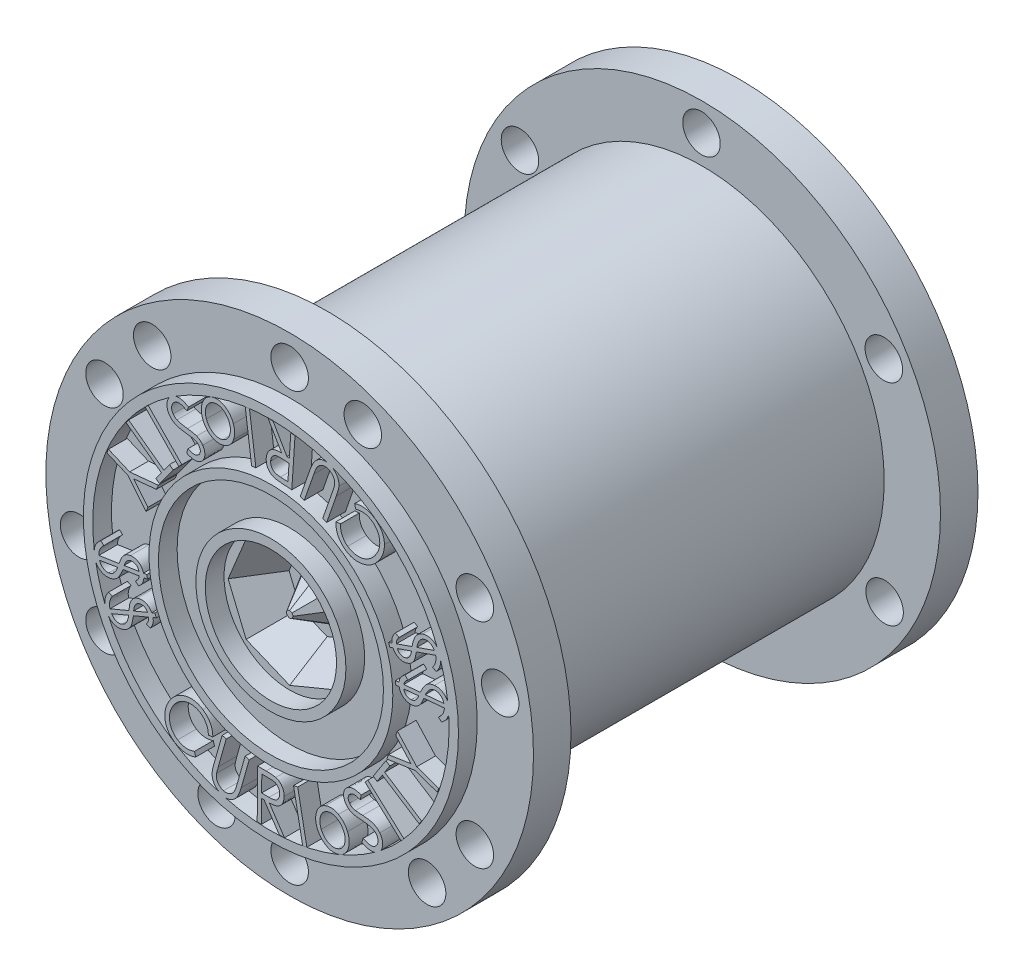
from build123d import *

# Parameters (mm, degrees)
SKETCH1_R           = 6.5
BOSS_EXTRUDE1_DEPTH = 1
SKETCH2_R           = 2
SKETCH2_R_2         = 1.75
BOSS_EXTRUDE2_DEPTH = 0.5
SKETCH3_R           = 3.25
SKETCH3_R_2         = 3
BOSS_EXTRUDE3_DEPTH = 0.5
SKETCH5_R           = 5
SKETCH5_R_2         = 4.75
BOSS_EXTRUDE5_DEPTH = 0.5
BOSS_EXTRUDE6_DEPTH = 0.5
SKETCH8_R           = 4.85
BOSS_EXTRUDE7_DEPTH = 10
SKETCH9_R           = 6.35
BOSS_EXTRUDE8_DEPTH = 1
CUT_EXTRUDE3_DEPTH  = 1
CUT_EXTRUDE3_DRAFT  = -30
BOSS_EXTRUDE9_DEPTH = 1
BOSS_EXTRUDE9_TAPER = 30
SKETCH13_R          = 0.5
CUT_EXTRUDE4_DEPTH  = 1
CUT_EXTRUDE5_DEPTH  = 2
SKETCH15_R          = 0.5
CUT_EXTRUDE6_DEPTH  = 2
SCALE2_SCALE        = 20
SKETCH16_R          = 129.994642197
SKETCH16_R_2        = 99.994642197
CUT_EXTRUDE7_DEPTH  = 254


with BuildPart() as part:
    # Sketch1 → Boss-Extrude1 (new body)
    with BuildSketch(Plane.XY):
        Circle(SKETCH1_R)
    extrude(amount=BOSS_EXTRUDE1_DEPTH)

    # Sketch2 → Boss-Extrude2 (add)
    with BuildSketch(Plane.XY.offset(1)):
        Circle(SKETCH2_R)
        Circle(SKETCH2_R_2, mode=Mode.SUBTRACT)
    extrude(amount=BOSS_EXTRUDE2_DEPTH)

    # Sketch3 → Boss-Extrude3 (add)
    with BuildSketch(Plane.XY.offset(1)):
        Circle(SKETCH3_R)
        Circle(SKETCH3_R_2, mode=Mode.SUBTRACT)
    extrude(amount=BOSS_EXTRUDE3_DEPTH)

    # Sketch5 → Boss-Extrude5 (add)
    with BuildSketch(Plane.XY.offset(1)):
        Circle(SKETCH5_R)
        Circle(SKETCH5_R_2, mode=Mode.SUBTRACT)
    extrude(amount=BOSS_EXTRUDE5_DEPTH)

    # Sketch7 → Boss-Extrude6 (add)
    # profile 1 of 22: a face of its own
    with BuildSketch(Plane.XY.offset(1)):
        with BuildLine():
            Line((3.3296875, 0.28046875), (3.320572917, 0.380729167))
            Line((3.320572917, 0.380729167), (3.41640625, 0.389322917))
            add(Edge.make_bspline(
                [(3.41640625, 0.389322917), (3.418136436, 0.401699518), (3.421523867, 0.42593094), (3.431006392, 0.460704987), (3.443815605, 0.493045399), (3.460245684, 0.523367199), (3.481139884, 0.552254606), (3.506567877, 0.580554488), (3.536722727, 0.608864998), (3.559309397, 0.626484367), (3.57109375, 0.635677083)],
                knots=[0, 0, 0, 0, 0.997561335, 1.95306681, 2.871227801, 3.771137479, 4.700620562, 5.712469569, 6.806505544, 8, 8, 8, 8], degree=3))
            Line((3.57109375, 0.635677083), (3.654947917, 0.559895833))
            add(Edge.make_bspline(
                [(3.654947917, 0.559895833), (3.647035757, 0.554207912), (3.631627441, 0.543131126), (3.610838114, 0.524877085), (3.592621111, 0.506040461), (3.577188932, 0.486345321), (3.564069479, 0.466137212), (3.553749421, 0.44509846), (3.546384424, 0.423254492), (3.543415557, 0.408285912), (3.541927083, 0.40078125)],
                knots=[0, 0, 0, 0, 1.164252726, 2.267291727, 3.302086058, 4.292269066, 5.253652206, 6.177162314, 7.086100284, 8, 8, 8, 8], degree=3))
            Line((3.541927083, 0.40078125), (3.98046875, 0.440625))
            add(Edge.make_bspline(
                [(3.98046875, 0.440625), (3.988812058, 0.457503367), (4.00477851, 0.489803222), (4.028883119, 0.535517843), (4.052498959, 0.576045633), (4.07423998, 0.612212182), (4.095913719, 0.642918724), (4.115590546, 0.669448493), (4.134853228, 0.690864854), (4.148242589, 0.702457775), (4.154427083, 0.7078125)],
                knots=[0, 0, 0, 0, 1.408616411, 2.69564613, 3.865279239, 4.917865696, 5.851066282, 6.675874903, 7.38839175, 8, 8, 8, 8], degree=3))
            add(Edge.make_bspline(
                [(4.154427083, 0.7078125), (4.162076894, 0.713561334), (4.177275709, 0.724983245), (4.201265447, 0.740126021), (4.226267522, 0.753122944), (4.251791866, 0.764723116), (4.278414546, 0.773665509), (4.30553913, 0.781443297), (4.333619665, 0.786828913), (4.352674751, 0.78900957), (4.362239583, 0.790104167)],
                knots=[0, 0, 0, 0, 1.012917258, 2.012486745, 2.999170095, 3.994887009, 4.977323403, 5.969641086, 6.980847299, 8, 8, 8, 8], degree=3))
            add(Edge.make_bspline(
                [(4.362239583, 0.790104167), (4.378125713, 0.790942027), (4.409442065, 0.792593701), (4.456089874, 0.788040022), (4.501065967, 0.777269958), (4.544068289, 0.760773757), (4.584396735, 0.739379835), (4.620812226, 0.712789049), (4.653421773, 0.681969429), (4.671248062, 0.658094388), (4.680208333, 0.64609375)],
                knots=[0, 0, 0, 0, 1.042623336, 2.055324959, 3.062357547, 4.068246045, 5.069609897, 6.048169304, 7.018924671, 8, 8, 8, 8], degree=3))
            add(Edge.make_bspline(
                [(4.680208333, 0.64609375), (4.685807825, 0.637271878), (4.697659719, 0.618599487), (4.711803751, 0.586482392), (4.725013565, 0.549796761), (4.731824276, 0.52333341), (4.735416667, 0.509375)],
                knots=[0, 0, 0, 0, 0.845047639, 1.788629503, 2.833586284, 4, 4, 4, 4], degree=3))
            Line((4.735416667, 0.509375), (5.010677083, 0.534375))
            Line((5.010677083, 0.534375), (5.019791667, 0.434114583))
            Line((5.019791667, 0.434114583), (4.74453125, 0.409114583))
            add(Edge.make_bspline(
                [(4.74453125, 0.409114583), (4.744315331, 0.394085974), (4.743902652, 0.365362296), (4.73990453, 0.324565889), (4.734045309, 0.288023056), (4.724601196, 0.255467488), (4.712515347, 0.225145219), (4.697368984, 0.195653347), (4.678552143, 0.166450186), (4.657304923, 0.137289182), (4.633093809, 0.10925223), (4.606601872, 0.082869588), (4.577515557, 0.058836664), (4.556790526, 0.04447273), (4.546354167, 0.037239583)],
                knots=[0, 0, 0, 0, 1.224059217, 2.339503368, 3.337131794, 4.234786489, 5.095022903, 5.993346034, 6.931223718, 7.922842355, 8.930845878, 9.94606859, 10.965716023, 12, 12, 12, 12], degree=3))
            Line((4.546354167, 0.037239583), (4.467708333, 0.1125))
            add(Edge.make_bspline(
                [(4.467708333, 0.1125), (4.479807352, 0.122603673), (4.503365127, 0.142276348), (4.534443264, 0.17487534), (4.561233734, 0.208480412), (4.583447571, 0.243548468), (4.600395892, 0.280330814), (4.612920094, 0.318324972), (4.62144693, 0.357707085), (4.622769292, 0.384591833), (4.6234375, 0.398177083)],
                knots=[0, 0, 0, 0, 1.123058454, 2.186686272, 3.204457077, 4.183227205, 5.138490192, 6.083757324, 7.031694937, 8, 8, 8, 8], degree=3))
            Line((4.6234375, 0.398177083), (4.079427083, 0.348697917))
            add(Edge.make_bspline(
                [(4.079427083, 0.348697917), (4.074967749, 0.338603381), (4.06647553, 0.319379657), (4.053494492, 0.292304321), (4.042099519, 0.267882509), (4.032022731, 0.246146935), (4.022745454, 0.227466955), (4.014216335, 0.211817284), (4.007379859, 0.198723745), (4.002808448, 0.191128527), (4.00078125, 0.187760417)],
                knots=[0, 0, 0, 0, 1.477773535, 2.814226416, 4.020748787, 5.086817516, 6.022599564, 6.813089089, 7.473662714, 8, 8, 8, 8], degree=3))
            add(Edge.make_bspline(
                [(4.00078125, 0.187760417), (3.993191328, 0.176740114), (3.978374634, 0.155226792), (3.952880317, 0.126482961), (3.925795859, 0.101486826), (3.8965656, 0.080673783), (3.865092777, 0.063740096), (3.830985459, 0.050669259), (3.793946325, 0.041564023), (3.768185996, 0.038363487), (3.754947917, 0.03671875)],
                knots=[0, 0, 0, 0, 1.070526026, 2.089831202, 3.068815888, 4.015721093, 4.954814578, 5.922858327, 6.932569324, 8, 8, 8, 8], degree=3))
            add(Edge.make_bspline(
                [(3.754947917, 0.03671875), (3.741925692, 0.035954939), (3.716279295, 0.034450664), (3.678098906, 0.037926175), (3.640869286, 0.045005927), (3.605088429, 0.057098555), (3.571225012, 0.072975538), (3.539900508, 0.092228755), (3.511362646, 0.114850632), (3.485933478, 0.141142186), (3.463301918, 0.17131205), (3.445406472, 0.206568607), (3.429899834, 0.245697648), (3.423410119, 0.273932062), (3.420052083, 0.288541667)],
                knots=[0, 0, 0, 0, 1.015045499, 1.999064039, 2.977932628, 3.961741968, 4.932940396, 5.886433604, 6.820149082, 7.762374227, 8.729537432, 9.746023926, 10.833703457, 12, 12, 12, 12], degree=3))
            Line((3.420052083, 0.288541667), (3.3296875, 0.28046875))
        make_face()
        with BuildLine():
            add(Edge.make_bspline(
                [(3.5421875, 0.299739583), (3.544188519, 0.290755228), (3.548028495, 0.273514162), (3.55628478, 0.249270828), (3.566952875, 0.22809418), (3.579699662, 0.209712756), (3.594395322, 0.193865309), (3.611361316, 0.180584615), (3.629912451, 0.16904688), (3.650232893, 0.159573972), (3.672034196, 0.153076473), (3.694669689, 0.14837733), (3.718226844, 0.146949582), (3.73411827, 0.147763698), (3.7421875, 0.148177083)],
                knots=[0, 0, 0, 0, 1.188208703, 2.28018411, 3.297935782, 4.240219317, 5.160301368, 6.077716013, 7.014112727, 7.977173514, 8.962934083, 9.945694046, 10.956879909, 12, 12, 12, 12], degree=3))
            add(Edge.make_bspline(
                [(3.7421875, 0.148177083), (3.752317933, 0.149532274), (3.772016222, 0.152167396), (3.799762043, 0.160884235), (3.8249843, 0.173078164), (3.839246584, 0.184441346), (3.846354167, 0.190104167)],
                knots=[0, 0, 0, 0, 1.073325077, 2.087044719, 3.046682322, 4, 4, 4, 4], degree=3))
            add(Edge.make_bspline(
                [(3.846354167, 0.190104167), (3.85567901, 0.198864874), (3.875198738, 0.217203693), (3.899720957, 0.251517937), (3.922928068, 0.29129351), (3.935565688, 0.320758804), (3.9421875, 0.336197917)],
                knots=[0, 0, 0, 0, 0.869199987, 1.819499358, 2.857469547, 4, 4, 4, 4], degree=3))
            Line((3.9421875, 0.336197917), (3.5421875, 0.299739583))
        make_face(mode=Mode.SUBTRACT)
        with BuildLine():
            add(Edge.make_bspline(
                [(4.610677083, 0.497916667), (4.606277502, 0.512416919), (4.597744317, 0.540540807), (4.577511938, 0.579001742), (4.551841853, 0.612355007), (4.520684561, 0.639399514), (4.48676817, 0.660971808), (4.450669251, 0.675416133), (4.41318291, 0.68337057), (4.387966424, 0.682306828), (4.375260417, 0.681770833)],
                knots=[0, 0, 0, 0, 1.116762554, 2.166010933, 3.189074265, 4.206218183, 5.196743158, 6.142917748, 7.06425899, 8, 8, 8, 8], degree=3))
            add(Edge.make_bspline(
                [(4.375260417, 0.681770833), (4.362845065, 0.680191924), (4.338257025, 0.677064966), (4.303001121, 0.665022722), (4.269550692, 0.648531752), (4.2433705, 0.630450646), (4.223363386, 0.612862526), (4.208274142, 0.59713349), (4.193104943, 0.578998851), (4.177912492, 0.558495544), (4.162413971, 0.535720277), (4.147083429, 0.510398635), (4.131873497, 0.482554506), (4.121835536, 0.46312822), (4.116666667, 0.453125)],
                knots=[0, 0, 0, 0, 1.239610435, 2.45499221, 3.676650975, 4.933986324, 5.599533306, 6.318655803, 7.09541281, 7.945084802, 8.85093135, 9.829294199, 10.882233651, 12, 12, 12, 12], degree=3))
            Line((4.116666667, 0.453125), (4.610677083, 0.497916667))
        make_face(mode=Mode.SUBTRACT)
    # profile 2 of 22: a face of its own
    with BuildSketch(Plane.XY.offset(1)):
        with BuildLine():
            Line((3.169711851, 1.074106685), (3.136638934, 1.168898352))
            Line((3.136638934, 1.168898352), (3.227003518, 1.200408768))
            add(Edge.make_bspline(
                [(3.227003518, 1.200408768), (3.225798833, 1.212807818), (3.223434737, 1.237139957), (3.224202243, 1.27314382), (3.228948447, 1.307538878), (3.237301379, 1.34085629), (3.250626742, 1.373735562), (3.2680839, 1.407401587), (3.290824187, 1.441805906), (3.308275095, 1.464411238), (3.317368101, 1.476190018)],
                knots=[0, 0, 0, 0, 0.997415494, 1.95734789, 2.876932687, 3.774264451, 4.701496001, 5.712397204, 6.808016955, 8, 8, 8, 8], degree=3))
            Line((3.317368101, 1.476190018), (3.416586851, 1.423325435))
            add(Edge.make_bspline(
                [(3.416586851, 1.423325435), (3.410301726, 1.415868793), (3.398147471, 1.401449042), (3.382376947, 1.378800636), (3.369241633, 1.35621149), (3.359074322, 1.333391468), (3.351270314, 1.310598248), (3.346743371, 1.287657393), (3.344337519, 1.264678796), (3.345280293, 1.249456066), (3.345753518, 1.241815018)],
                knots=[0, 0, 0, 0, 1.167014531, 2.256787637, 3.299613733, 4.290447188, 5.243499454, 6.176972248, 7.084931486, 8, 8, 8, 8], degree=3))
            Line((3.345753518, 1.241815018), (3.760076434, 1.386085852))
            add(Edge.make_bspline(
                [(3.760076434, 1.386085852), (3.764046718, 1.404427609), (3.771651875, 1.439561611), (3.784283618, 1.489521994), (3.796495848, 1.534736082), (3.809652269, 1.574772353), (3.822349662, 1.610059479), (3.835847783, 1.640093177), (3.848629929, 1.665791001), (3.858949398, 1.680201901), (3.863722268, 1.686867102)],
                knots=[0, 0, 0, 0, 1.406923446, 2.694989915, 3.863474375, 4.917268543, 5.854225945, 6.672988849, 7.386242626, 8, 8, 8, 8], degree=3))
            add(Edge.make_bspline(
                [(3.863722268, 1.686867102), (3.869691919, 1.694251018), (3.881569237, 1.70894218), (3.901217292, 1.729263959), (3.922083665, 1.747967988), (3.94398784, 1.765386234), (3.967431123, 1.78066742), (3.992113001, 1.794114686), (4.017643677, 1.806715196), (4.035614573, 1.813247699), (4.044711851, 1.816554602)],
                knots=[0, 0, 0, 0, 1.008748312, 2.007022336, 2.999953501, 3.985485544, 4.978288128, 5.969331752, 6.972029339, 8, 8, 8, 8], degree=3))
            add(Edge.make_bspline(
                [(4.044711851, 1.816554602), (4.059803811, 1.82121377), (4.089670457, 1.830434157), (4.135800455, 1.837055373), (4.181867233, 1.837676604), (4.227386525, 1.831836238), (4.271361458, 1.820437979), (4.313174924, 1.803962244), (4.351992848, 1.781757282), (4.375233766, 1.763139317), (4.386899351, 1.753794185)],
                knots=[0, 0, 0, 0, 1.038903057, 2.055965493, 3.056457089, 4.064757772, 5.068624487, 6.041021843, 7.016707282, 8, 8, 8, 8], degree=3))
            add(Edge.make_bspline(
                [(4.386899351, 1.753794185), (4.394357204, 1.746568578), (4.410206675, 1.731212677), (4.431763841, 1.703584544), (4.453321907, 1.671046237), (4.46626654, 1.646968479), (4.473097268, 1.634262935)],
                knots=[0, 0, 0, 0, 0.840506302, 1.786248763, 2.831830049, 4, 4, 4, 4], degree=3))
            Line((4.473097268, 1.634262935), (4.732732684, 1.724627518))
            Line((4.732732684, 1.724627518), (4.765805601, 1.629835852))
            Line((4.765805601, 1.629835852), (4.506170184, 1.539471268))
            add(Edge.make_bspline(
                [(4.506170184, 1.539471268), (4.509600571, 1.524844499), (4.516138026, 1.496969551), (4.522075675, 1.456468487), (4.524988842, 1.419643651), (4.52406081, 1.385746354), (4.519188693, 1.353482659), (4.512089427, 1.321155709), (4.501118085, 1.288243008), (4.487501788, 1.254941509), (4.470892773, 1.222013059), (4.45155163, 1.190100195), (4.429490009, 1.159546525), (4.412756691, 1.140639678), (4.404347268, 1.131137935)],
                knots=[0, 0, 0, 0, 1.225503443, 2.335501715, 3.33681456, 4.236892674, 5.095426266, 5.995922406, 6.934534902, 7.922453087, 8.929861196, 9.940625891, 10.965049855, 12, 12, 12, 12], degree=3))
            Line((4.404347268, 1.131137935), (4.310076434, 1.185304602))
            add(Edge.make_bspline(
                [(4.310076434, 1.185304602), (4.31936924, 1.197976169), (4.337474682, 1.22266455), (4.359594927, 1.261794193), (4.377277135, 1.300867215), (4.38994551, 1.340362856), (4.397788434, 1.380041469), (4.400984217, 1.419884855), (4.399323066, 1.460006204), (4.394187896, 1.486306167), (4.391586851, 1.499627518)],
                knots=[0, 0, 0, 0, 1.121822704, 2.185679551, 3.204531251, 4.181270049, 5.142128439, 6.087734781, 7.031407095, 8, 8, 8, 8], degree=3))
            Line((4.391586851, 1.499627518), (3.877784768, 1.320721268))
            add(Edge.make_bspline(
                [(3.877784768, 1.320721268), (3.875784483, 1.309871369), (3.871975346, 1.289209933), (3.866588777, 1.259662973), (3.861299367, 1.233307675), (3.856819652, 1.209872887), (3.851854164, 1.189678293), (3.848208319, 1.172304263), (3.844554063, 1.15805587), (3.841961884, 1.149706191), (3.840805601, 1.145981685)],
                knots=[0, 0, 0, 0, 1.481779092, 2.821748342, 4.033561632, 5.092178362, 6.025442709, 6.825900088, 7.476274157, 8, 8, 8, 8], degree=3))
            add(Edge.make_bspline(
                [(3.840805601, 1.145981685), (3.836103553, 1.1334642), (3.826934396, 1.109054673), (3.8093515, 1.074958193), (3.789033772, 1.044360428), (3.765925949, 1.017084615), (3.739350672, 0.993353871), (3.70959516, 0.972478409), (3.676069149, 0.954538239), (3.651944285, 0.945284781), (3.639503518, 0.940512935)],
                knots=[0, 0, 0, 0, 1.073198796, 2.092774715, 3.073078349, 4.017525936, 4.955441228, 5.926354454, 6.930657482, 8, 8, 8, 8], degree=3))
            add(Edge.make_bspline(
                [(3.639503518, 0.940512935), (3.627078199, 0.936656963), (3.602619523, 0.929066656), (3.564817744, 0.922889707), (3.527061944, 0.920948353), (3.4894542, 0.923883146), (3.45294777, 0.9311561), (3.418023825, 0.942337328), (3.385226331, 0.957687756), (3.354009234, 0.976615568), (3.325471819, 1.001087777), (3.298890064, 1.030199526), (3.275130464, 1.064943578), (3.261959042, 1.090698462), (3.255128518, 1.104054602)],
                knots=[0, 0, 0, 0, 1.014989287, 1.997960308, 2.982076098, 3.961112033, 4.935631272, 5.883204462, 6.817369823, 7.75800652, 8.724951047, 9.742314633, 10.829194431, 12, 12, 12, 12], degree=3))
            Line((3.255128518, 1.104054602), (3.169711851, 1.074106685))
        make_face()
        with BuildLine():
            add(Edge.make_bspline(
                [(3.370493101, 1.144158768), (3.374571431, 1.135816759), (3.382342981, 1.119920463), (3.396336614, 1.098442905), (3.411577104, 1.080405472), (3.428368149, 1.065679183), (3.446536579, 1.054163893), (3.46602446, 1.045265425), (3.486758368, 1.038736495), (3.508600539, 1.034595865), (3.531253687, 1.032962771), (3.554304911, 1.034441958), (3.577618884, 1.038153086), (3.592765627, 1.043003152), (3.600441018, 1.045460852)],
                knots=[0, 0, 0, 0, 1.200955241, 2.288505929, 3.308496171, 4.248095128, 5.16752765, 6.08248736, 7.013448625, 7.974170775, 8.953952469, 9.944242193, 10.958274788, 12, 12, 12, 12], degree=3))
            add(Edge.make_bspline(
                [(3.600441018, 1.045460852), (3.609956881, 1.049161718), (3.628314948, 1.056301454), (3.652930468, 1.071556216), (3.674232983, 1.089457839), (3.68531553, 1.103921062), (3.690805601, 1.111085852)],
                knots=[0, 0, 0, 0, 1.07739383, 2.07851549, 3.048135188, 4, 4, 4, 4], degree=3))
            add(Edge.make_bspline(
                [(3.690805601, 1.111085852), (3.697631445, 1.121941331), (3.711840687, 1.144538995), (3.727733477, 1.183517714), (3.740106617, 1.227692576), (3.745525312, 1.259200091), (3.748357684, 1.275669185)],
                knots=[0, 0, 0, 0, 0.873880332, 1.819141662, 2.860057325, 4, 4, 4, 4], degree=3))
            Line((3.748357684, 1.275669185), (3.370493101, 1.144158768))
        make_face(mode=Mode.SUBTRACT)
        with BuildLine():
            add(Edge.make_bspline(
                [(4.355128518, 1.593117102), (4.351321075, 1.599860922), (4.343890139, 1.613022747), (4.331205586, 1.631513915), (4.317503597, 1.648294331), (4.302816424, 1.663685257), (4.286867602, 1.677069271), (4.270187381, 1.68935826), (4.252055712, 1.699291172), (4.227505671, 1.711050579), (4.195844965, 1.72147065), (4.157394425, 1.726832453), (4.119253719, 1.72500608), (4.095137246, 1.717999512), (4.082993101, 1.714471268)],
                knots=[0, 0, 0, 0, 0.858297538, 1.675128, 2.48226314, 3.258155994, 4.029559555, 4.788068658, 5.550839423, 6.317123326, 7.805326085, 9.223517951, 10.601868436, 12, 12, 12, 12], degree=3))
            add(Edge.make_bspline(
                [(4.082993101, 1.714471268), (4.071445596, 1.709974523), (4.048539883, 1.701054747), (4.017254932, 1.68119675), (3.988911543, 1.657189403), (3.968247428, 1.633209733), (3.952971002, 1.611627009), (3.942363076, 1.59256436), (3.932056331, 1.571339546), (3.922050799, 1.54784527), (3.913153686, 1.52189398), (3.904088106, 1.493776846), (3.896281158, 1.463077189), (3.89129161, 1.441822509), (3.888722268, 1.430877518)],
                knots=[0, 0, 0, 0, 1.232198746, 2.444198151, 3.671256312, 4.92180415, 5.586426264, 6.303039965, 7.092137837, 7.937085972, 8.845269939, 9.824554368, 10.879765238, 12, 12, 12, 12], degree=3))
            Line((3.888722268, 1.430877518), (4.355128518, 1.593117102))
        make_face(mode=Mode.SUBTRACT)
    # profile 3 of 22: a face of its own
    with BuildSketch(Plane.XY.offset(1)):
        with BuildLine():
            Line((1.736929599, 3.256329652), (1.855679599, 3.265704652))
            add(Edge.make_bspline(
                [(1.855679599, 3.265704652), (1.85528252, 3.254767758), (1.854497723, 3.233151753), (1.855709243, 3.201075992), (1.85818662, 3.169764353), (1.862621421, 3.139230946), (1.868898642, 3.109598519), (1.876729918, 3.080703691), (1.886344752, 3.052589564), (1.89780339, 3.025300374), (1.910912558, 2.998895402), (1.925394289, 2.973425463), (1.941598126, 2.949000833), (1.95977087, 2.925969454), (1.978825402, 2.903322824), (2.000226965, 2.882454227), (2.022418576, 2.861807464), (2.038640773, 2.849512203), (2.046825432, 2.843308819)],
                knots=[0, 0, 0, 0, 1.08501511, 2.144456207, 3.181091947, 4.198897216, 5.201812159, 6.18336538, 7.16616363, 8.146243416, 9.116443113, 10.088131228, 11.050353814, 12.019827557, 12.996536563, 13.982684779, 14.982194731, 16, 16, 16, 16], degree=3))
            add(Edge.make_bspline(
                [(2.046825432, 2.843308819), (2.055926729, 2.836735328), (2.074023327, 2.823664902), (2.102768368, 2.806831528), (2.132312706, 2.792239663), (2.162599665, 2.779562605), (2.19392751, 2.769542601), (2.226070637, 2.761321743), (2.259164669, 2.755661631), (2.292929866, 2.752270022), (2.326946316, 2.751332325), (2.360880309, 2.752251759), (2.394445496, 2.755736682), (2.427701277, 2.761149834), (2.460592721, 2.769002868), (2.493090677, 2.77920635), (2.525305363, 2.791474058), (2.55695649, 2.806033048), (2.587984956, 2.822761585), (2.618200256, 2.841376514), (2.647113307, 2.862470015), (2.675269428, 2.884963329), (2.7022068, 2.90969372), (2.728268965, 2.936227555), (2.753280572, 2.964865227), (2.768892317, 2.985151402), (2.776773349, 2.995392152)],
                knots=[0, 0, 0, 0, 0.972167792, 1.933013403, 2.88141844, 3.825490451, 4.774372403, 5.728277211, 6.69756122, 7.680057816, 8.665657768, 9.64374109, 10.618755136, 11.586783917, 12.560811429, 13.545521603, 14.535729795, 15.545225345, 16.561337679, 17.588052827, 18.616996348, 19.659915232, 20.708566265, 21.78276509, 22.880708285, 24, 24, 24, 24], degree=3))
            add(Edge.make_bspline(
                [(2.776773349, 2.995392152), (2.788093199, 3.011171019), (2.810321525, 3.042155332), (2.838063283, 3.091152357), (2.86123459, 3.140546868), (2.879381583, 3.190718286), (2.892122464, 3.241696062), (2.900005458, 3.293309378), (2.90292621, 3.345640375), (2.900515186, 3.39813806), (2.893344042, 3.449689126), (2.881349446, 3.499170092), (2.864685527, 3.546261724), (2.842692444, 3.590575824), (2.815929699, 3.632298398), (2.784328548, 3.671308956), (2.748189519, 3.70810665), (2.720696785, 3.729545909), (2.706721265, 3.740444235)],
                knots=[0, 0, 0, 0, 1.113678629, 2.186885019, 3.225393099, 4.241681949, 5.243226848, 6.235850257, 7.233609851, 8.245800869, 9.246837756, 10.215781104, 11.1627072, 12.107258878, 13.048244284, 14.001230268, 14.983955333, 16, 16, 16, 16], degree=3))
            add(Edge.make_bspline(
                [(2.706721265, 3.740444235), (2.690761031, 3.751655596), (2.65930885, 3.773749365), (2.60781607, 3.798852713), (2.554712972, 3.818007638), (2.499238822, 3.829655565), (2.441881035, 3.83457568), (2.382468175, 3.83261947), (2.321094064, 3.823718176), (2.280240813, 3.812906503), (2.259325432, 3.807371319)],
                knots=[0, 0, 0, 0, 0.994043075, 1.958919969, 2.913150395, 3.868953009, 4.842819633, 5.844533515, 6.896479448, 8, 8, 8, 8], degree=3))
            Line((2.259325432, 3.807371319), (2.233804599, 3.923256735))
            add(Edge.make_bspline(
                [(2.233804599, 3.923256735), (2.245568395, 3.927047071), (2.268998325, 3.934596274), (2.304611504, 3.943273069), (2.340127384, 3.950203766), (2.37571173, 3.954649712), (2.411293652, 3.956663721), (2.446939287, 3.956653106), (2.482528835, 3.954681827), (2.518066678, 3.950087748), (2.553351977, 3.943787091), (2.588154962, 3.934701369), (2.622514401, 3.923943828), (2.656293415, 3.910469042), (2.689518931, 3.894914991), (2.722265001, 3.877029846), (2.754511453, 3.857136749), (2.775210662, 3.842221267), (2.785627515, 3.834715069)],
                knots=[0, 0, 0, 0, 1.018138265, 2.027823964, 3.018247038, 3.998622967, 4.980250639, 5.953055984, 6.934683656, 7.915059585, 8.904164455, 9.886104815, 10.876941082, 11.869170605, 12.88035009, 13.898211923, 14.942277576, 16, 16, 16, 16], degree=3))
            add(Edge.make_bspline(
                [(2.785627515, 3.834715069), (2.795338425, 3.827257302), (2.814519491, 3.812526662), (2.841689193, 3.789014116), (2.866922557, 3.764520934), (2.890339272, 3.73933937), (2.911949493, 3.713291995), (2.931618504, 3.686424338), (2.949345067, 3.658576519), (2.965706056, 3.63024914), (2.979649507, 3.600724918), (2.991948094, 3.570480285), (3.002362197, 3.539425784), (3.011016241, 3.507520677), (3.0176888, 3.474805475), (3.022777419, 3.441269742), (3.025520622, 3.406894377), (3.026179997, 3.383677446), (3.026512932, 3.371954652)],
                knots=[0, 0, 0, 0, 1.083510448, 2.140158519, 3.177896341, 4.194487628, 5.182099828, 6.17171212, 7.139248499, 8.102658253, 9.064841904, 10.026411918, 10.990923831, 11.961900865, 12.950319559, 13.944484143, 14.962119993, 16, 16, 16, 16], degree=3))
            add(Edge.make_bspline(
                [(3.026512932, 3.371954652), (3.026080402, 3.352054543), (3.025218078, 3.312380134), (3.017680289, 3.253200944), (3.005187004, 3.194842333), (2.987531997, 3.137109325), (2.964957019, 3.080068124), (2.936692085, 3.023945848), (2.90406145, 2.968180583), (2.878544191, 2.932696986), (2.865575432, 2.914662985)],
                knots=[0, 0, 0, 0, 0.967495402, 1.928874196, 2.895982685, 3.866852413, 4.861666941, 5.875504366, 6.920257305, 8, 8, 8, 8], degree=3))
            add(Edge.make_bspline(
                [(2.865575432, 2.914662985), (2.851206977, 2.896266106), (2.822961484, 2.860101539), (2.776106039, 2.811074822), (2.726688055, 2.767486582), (2.67442146, 2.729607329), (2.619509927, 2.697136807), (2.561882077, 2.670154029), (2.501547653, 2.648719514), (2.4391573, 2.633306697), (2.376232941, 2.62355692), (2.314007945, 2.620344651), (2.253140889, 2.623683624), (2.193677108, 2.633668633), (2.135505687, 2.650048489), (2.079113319, 2.673612038), (2.023869152, 2.703006477), (1.989378119, 2.727299914), (1.971825432, 2.739662985)],
                knots=[0, 0, 0, 0, 1.101602117, 2.165528302, 3.196514431, 4.208988188, 5.208529522, 6.204138969, 7.208784633, 8.226685735, 9.2341115, 10.21080471, 11.16315915, 12.106475074, 13.052280761, 14.009771785, 14.987161303, 16, 16, 16, 16], degree=3))
            add(Edge.make_bspline(
                [(1.971825432, 2.739662985), (1.961501796, 2.747723044), (1.941045665, 2.763693928), (1.91207942, 2.789152544), (1.885443514, 2.816105548), (1.860904606, 2.844278201), (1.838483267, 2.873643319), (1.818391609, 2.904376086), (1.800085617, 2.936007743), (1.784241972, 2.96897613), (1.770429118, 3.002697474), (1.758978409, 3.037267506), (1.749567157, 3.072291902), (1.742561257, 3.107976449), (1.737531638, 3.144223814), (1.734987069, 3.18111076), (1.734693007, 3.218597773), (1.736178649, 3.243660942), (1.736929599, 3.256329652)],
                knots=[0, 0, 0, 0, 1.058927814, 2.098249593, 3.115725788, 4.120705183, 5.117439337, 6.100561739, 7.087834781, 8.070430852, 9.05583077, 10.032467162, 11.013156058, 11.986381382, 12.971106103, 13.970283993, 14.974037055, 16, 16, 16, 16], degree=3))
        make_face()
    # profile 4 of 22: a face of its own
    with BuildSketch(Plane.XY.offset(1)):
        with BuildLine():
            Line((1.486421648, 3.1126229), (1.379911232, 3.149862484))
            Line((1.379911232, 3.149862484), (1.636421648, 3.887102067))
            add(Edge.make_bspline(
                [(1.636421648, 3.887102067), (1.639981248, 3.8975186), (1.646745397, 3.917312673), (1.65637677, 3.945525079), (1.665101325, 3.970599102), (1.672007603, 3.99283278), (1.678069387, 4.011907582), (1.683020734, 4.027939348), (1.686773517, 4.040940287), (1.688531575, 4.048640468), (1.689286232, 4.051945817)],
                knots=[0, 0, 0, 0, 1.525599952, 2.899029347, 4.131672662, 5.204616361, 6.125402608, 6.905532898, 7.530193456, 8, 8, 8, 8], degree=3))
            add(Edge.make_bspline(
                [(1.689286232, 4.051945817), (1.691814558, 4.064056921), (1.696694784, 4.087434012), (1.699381778, 4.122121831), (1.699094656, 4.154680044), (1.695010093, 4.185560916), (1.686460836, 4.215024803), (1.673510407, 4.243692733), (1.655886634, 4.27171503), (1.633826132, 4.298187777), (1.609436984, 4.32306904), (1.582446326, 4.343886262), (1.554110366, 4.361033976), (1.533945397, 4.369053275), (1.523921648, 4.373039567)],
                knots=[0, 0, 0, 0, 1.118010752, 2.158006407, 3.139574504, 4.058976074, 4.965990361, 5.904306861, 6.895530727, 7.950124353, 9.016084749, 10.040071245, 11.025744438, 12, 12, 12, 12], degree=3))
            add(Edge.make_bspline(
                [(1.523921648, 4.373039567), (1.515042022, 4.375820922), (1.497442803, 4.381333506), (1.469786675, 4.384958401), (1.441739225, 4.385953154), (1.413347858, 4.382871668), (1.38530557, 4.376962777), (1.358017071, 4.367913151), (1.332050971, 4.355075913), (1.307002568, 4.339601792), (1.283445201, 4.320491389), (1.260994816, 4.298641992), (1.240035474, 4.273448216), (1.227661734, 4.254930028), (1.221317482, 4.2454354)],
                knots=[0, 0, 0, 0, 0.940711181, 1.864468235, 2.814295879, 3.777415818, 4.748169059, 5.712852538, 6.680096349, 7.675340908, 8.688594136, 9.745454326, 10.844051463, 12, 12, 12, 12], degree=3))
            add(Edge.make_bspline(
                [(1.221317482, 4.2454354), (1.218948015, 4.24137026), (1.213665057, 4.23230663), (1.205554675, 4.216939567), (1.197149503, 4.198253964), (1.188035587, 4.176389318), (1.177835331, 4.151558536), (1.167217176, 4.123284436), (1.155841337, 4.091916553), (1.148039537, 4.069919637), (1.143973732, 4.058456234)],
                knots=[0, 0, 0, 0, 0.557259466, 1.242464958, 2.056736398, 2.982817582, 4.0481203, 5.235776793, 6.559461427, 8, 8, 8, 8], degree=3))
            Line((1.143973732, 4.058456234), (0.887463315, 3.32121665))
            Line((0.887463315, 3.32121665), (0.780952898, 3.358195817))
            Line((0.780952898, 3.358195817), (1.037463315, 4.0954354))
            add(Edge.make_bspline(
                [(1.037463315, 4.0954354), (1.042157804, 4.108746376), (1.051313489, 4.134706838), (1.066019819, 4.172137477), (1.080466185, 4.207528474), (1.095628021, 4.240301912), (1.11046978, 4.271176636), (1.12571676, 4.299563832), (1.141162537, 4.325813108), (1.156834259, 4.349983576), (1.173294556, 4.372450872), (1.191427914, 4.39307906), (1.210895108, 4.412346736), (1.2318775, 4.430070265), (1.254127583, 4.446672505), (1.278025336, 4.461656705), (1.303343441, 4.475234915), (1.329876281, 4.487161758), (1.357165825, 4.497405769), (1.385173649, 4.504774732), (1.413547008, 4.509037162), (1.442120286, 4.511426317), (1.470974168, 4.510055099), (1.500090656, 4.506786201), (1.529520283, 4.500609392), (1.548801839, 4.494233903), (1.558557065, 4.491008317)],
                knots=[0, 0, 0, 0, 1.37388661, 2.679497762, 3.914535528, 5.094336609, 6.194103174, 7.248895865, 8.230034782, 9.15817825, 10.052228851, 10.93857889, 11.828907849, 12.716143635, 13.610194236, 14.529214539, 15.459241003, 16.404762947, 17.359192165, 18.293814027, 19.217677737, 20.149660014, 21.07980164, 22.024190091, 23.000367464, 24, 24, 24, 24], degree=3))
            add(Edge.make_bspline(
                [(1.558557065, 4.491008317), (1.569047991, 4.487195194), (1.589762512, 4.479666115), (1.619066649, 4.465441343), (1.646634941, 4.449806319), (1.672333537, 4.432319515), (1.695949189, 4.412783129), (1.717734046, 4.391540488), (1.737617974, 4.368615978), (1.75522591, 4.343838665), (1.770828321, 4.317897224), (1.784142447, 4.290982549), (1.795170165, 4.263411423), (1.803450962, 4.234940431), (1.809832238, 4.205822975), (1.813430484, 4.175830582), (1.814431897, 4.145080453), (1.813472102, 4.124425722), (1.812984148, 4.113924984)],
                knots=[0, 0, 0, 0, 1.089601345, 2.151437369, 3.17676611, 4.183273388, 5.183080694, 6.166358724, 7.152192151, 8.142717537, 9.131463328, 10.10592913, 11.072618337, 12.027636824, 12.998777424, 13.980994843, 14.973550145, 16, 16, 16, 16], degree=3))
            add(Edge.make_bspline(
                [(1.812984148, 4.113924984), (1.812261596, 4.106886775), (1.810686355, 4.091542726), (1.80678831, 4.066907429), (1.800602375, 4.038987629), (1.792702933, 4.007663251), (1.783198217, 3.972864179), (1.771204135, 3.934885176), (1.758107536, 3.893358112), (1.748132197, 3.864766998), (1.742932065, 3.849862484)],
                knots=[0, 0, 0, 0, 0.620101203, 1.351887047, 2.184619121, 3.125769135, 4.183494428, 5.345940641, 6.616441899, 8, 8, 8, 8], degree=3))
            Line((1.742932065, 3.849862484), (1.486421648, 3.1126229))
        make_face()
    # profile 5 of 22: a face of its own
    with BuildSketch(Plane.XY.offset(1)):
        with BuildLine():
            Line((0.556934641, 3.401210838), (0.332715891, 3.416054588))
            add(Edge.make_bspline(
                [(0.332715891, 3.416054588), (0.317698044, 3.417174401), (0.28895682, 3.419317504), (0.247776628, 3.42252505), (0.21053985, 3.426475188), (0.177117199, 3.430648761), (0.147367189, 3.434887977), (0.121543541, 3.439951273), (0.099344946, 3.444596087), (0.086162899, 3.44877273), (0.080111724, 3.450690005)],
                knots=[0, 0, 0, 0, 1.414702032, 2.707463277, 3.879951298, 4.931847336, 5.871737139, 6.701773266, 7.404053261, 8, 8, 8, 8], degree=3))
            add(Edge.make_bspline(
                [(0.080111724, 3.450690005), (0.072064149, 3.4535798), (0.056118229, 3.459305803), (0.033373885, 3.47047319), (0.011719221, 3.483068733), (-0.008328799, 3.497855364), (-0.027371023, 3.513996608), (-0.044627163, 3.53244053), (-0.061330247, 3.552137498), (-0.075868076, 3.574080076), (-0.089395751, 3.597086814), (-0.100130863, 3.621773504), (-0.109403308, 3.647295276), (-0.116327144, 3.674085959), (-0.121703655, 3.701896041), (-0.12431191, 3.730928553), (-0.125554293, 3.760936367), (-0.124560383, 3.781246809), (-0.124054943, 3.791575421)],
                knots=[0, 0, 0, 0, 0.955413817, 1.893111133, 2.828645825, 3.752781943, 4.67503014, 5.615536441, 6.573707307, 7.559024448, 8.554661817, 9.553982722, 10.564040498, 11.588177705, 12.644734603, 13.727407184, 14.844302405, 16, 16, 16, 16], degree=3))
            add(Edge.make_bspline(
                [(-0.124054943, 3.791575421), (-0.122499497, 3.808656797), (-0.119468224, 3.841945185), (-0.107652669, 3.889636148), (-0.091284824, 3.933893913), (-0.069717948, 3.974406621), (-0.043121483, 4.01046579), (-0.012084102, 4.041591155), (0.023278004, 4.067503388), (0.056271664, 4.084297115), (0.08487452, 4.095510171), (0.10857282, 4.102059194), (0.133956635, 4.107554753), (0.161165091, 4.111768752), (0.190226429, 4.114215978), (0.221154976, 4.115491801), (0.253831699, 4.115585662), (0.276209123, 4.114345606), (0.287663807, 4.113710838)],
                knots=[0, 0, 0, 0, 1.378202834, 2.68585802, 3.93890689, 5.166812224, 6.365249163, 7.530674054, 8.690056956, 9.876982484, 10.498220276, 11.159170222, 11.852285385, 12.587138134, 13.372427159, 14.197246473, 15.077196136, 16, 16, 16, 16], degree=3))
            Line((0.287663807, 4.113710838), (-0.077179943, 4.741835838))
            Line((-0.077179943, 4.741835838), (0.062142974, 4.732721255))
            Line((0.062142974, 4.732721255), (0.426205474, 4.104596255))
            Line((0.426205474, 4.104596255), (0.490528391, 4.100169171))
            Line((0.490528391, 4.100169171), (0.530372141, 4.701471255))
            Line((0.530372141, 4.701471255), (0.642872141, 4.694179588))
            Line((0.642872141, 4.694179588), (0.556934641, 3.401210838))
        make_face()
        with BuildLine():
            Line((0.452767974, 3.535065005), (0.482195057, 3.974648338))
            Line((0.482195057, 3.974648338), (0.288705474, 3.989492088))
            add(Edge.make_bspline(
                [(0.288705474, 3.989492088), (0.279593002, 3.989979264), (0.262070083, 3.990916083), (0.236624183, 3.991419644), (0.212994521, 3.991262112), (0.190993603, 3.990023246), (0.170864328, 3.987577887), (0.152383334, 3.984861811), (0.135719764, 3.981025183), (0.116132471, 3.974472495), (0.09394911, 3.963886321), (0.069781955, 3.947583434), (0.048553788, 3.926993528), (0.030495836, 3.902794129), (0.015672329, 3.875828474), (0.004143725, 3.846914099), (-0.003520216, 3.815959427), (-0.005735292, 3.794652924), (-0.006867443, 3.783762921)],
                knots=[0, 0, 0, 0, 1.059827156, 2.038005251, 2.95553788, 3.803938937, 4.595565657, 5.309978108, 5.972722463, 6.578492105, 7.70593811, 8.816121634, 9.949861247, 11.123427264, 12.31030008, 13.514137888, 14.72944688, 16, 16, 16, 16], degree=3))
            add(Edge.make_bspline(
                [(-0.006867443, 3.783762921), (-0.007239086, 3.773079202), (-0.007966755, 3.752160762), (-0.004171235, 3.721117233), (0.003682076, 3.691473519), (0.01510548, 3.663357225), (0.029663027, 3.63772035), (0.047502597, 3.615506604), (0.067514003, 3.596472723), (0.086886089, 3.5838365), (0.10430883, 3.575454524), (0.119627018, 3.569930179), (0.136957036, 3.564568208), (0.156425618, 3.560376124), (0.177952585, 3.556390201), (0.201594787, 3.553113523), (0.227371963, 3.550154626), (0.245295877, 3.548963797), (0.254590891, 3.548346255)],
                knots=[0, 0, 0, 0, 1.267315745, 2.481370595, 3.695906251, 4.897436809, 6.074420981, 7.181458487, 8.267586521, 9.339201696, 9.910625769, 10.559390097, 11.269926428, 12.062256294, 12.921124493, 13.868219879, 14.894497781, 16, 16, 16, 16], degree=3))
            Line((0.254590891, 3.548346255), (0.452767974, 3.535065005))
        make_face(mode=Mode.SUBTRACT)
    # profile 6 of 22: a face of its own
    with BuildSketch(Plane.XY.offset(1)):
        Polygon((-0.401043216, 3.431401357), (-0.513543216, 3.41629719), (-0.684376549, 4.697286773), (-0.571876549, 4.71239094), align=None)
    # profile 7 of 22: a face of its own
    with BuildSketch(Plane.XY.offset(1)):
        with BuildLine():
            add(Edge.make_bspline(
                [(-1.243614118, 3.527265254), (-1.258622779, 3.522465604), (-1.28816512, 3.5130182), (-1.333614656, 3.505431065), (-1.378598269, 3.502606913), (-1.423381156, 3.505576117), (-1.467814772, 3.513920573), (-1.511942888, 3.528044788), (-1.555841744, 3.547229454), (-1.583795713, 3.563848291), (-1.598041201, 3.572317338)],
                knots=[0, 0, 0, 0, 1.019341286, 2.006423309, 2.975001609, 3.9327021, 4.905188075, 5.895530546, 6.927551403, 8, 8, 8, 8], degree=3))
            add(Edge.make_bspline(
                [(-1.598041201, 3.572317338), (-1.610880247, 3.580857126), (-1.636303234, 3.597767022), (-1.671444657, 3.627085359), (-1.703715504, 3.659108393), (-1.733238766, 3.693877302), (-1.759966164, 3.731296505), (-1.783654405, 3.771589258), (-1.804690321, 3.814654455), (-1.815998784, 3.844956453), (-1.821739118, 3.860338171)],
                knots=[0, 0, 0, 0, 0.994809148, 1.969852116, 2.948559464, 3.926512559, 4.910786605, 5.913142537, 6.940681931, 8, 8, 8, 8], degree=3))
            add(Edge.make_bspline(
                [(-1.821739118, 3.860338171), (-1.826869584, 3.87597266), (-1.836993115, 3.906822923), (-1.84735943, 3.95399987), (-1.853576325, 4.000873028), (-1.85604921, 4.047563784), (-1.854210419, 4.09393599), (-1.848170912, 4.140126663), (-1.837887121, 4.185996731), (-1.82400437, 4.231274452), (-1.806389276, 4.274691358), (-1.784636283, 4.314865056), (-1.759259973, 4.351333723), (-1.730173473, 4.384140663), (-1.697391897, 4.413130522), (-1.661187561, 4.438682045), (-1.621138341, 4.460115278), (-1.592528873, 4.471140991), (-1.577989118, 4.476744421)],
                knots=[0, 0, 0, 0, 1.069706435, 2.110764588, 3.136025779, 4.142285203, 5.148037647, 6.150170438, 7.167958064, 8.201965196, 9.227366287, 10.210115063, 11.167096126, 12.110929562, 13.054762997, 14.007119525, 14.98718867, 16, 16, 16, 16], degree=3))
            add(Edge.make_bspline(
                [(-1.577989118, 4.476744421), (-1.563057389, 4.481491827), (-1.533723142, 4.49081838), (-1.48898227, 4.499106436), (-1.444778698, 4.502370269), (-1.40105531, 4.500270747), (-1.357783848, 4.492907545), (-1.31505765, 4.48027934), (-1.272975568, 4.46234867), (-1.231908964, 4.439768613), (-1.192625255, 4.41331514), (-1.155732927, 4.383918106), (-1.122203756, 4.351483733), (-1.091330028, 4.316697612), (-1.064085165, 4.278791129), (-1.039724443, 4.238233931), (-1.018548655, 4.194884427), (-1.007008695, 4.164515532), (-1.001166201, 4.149140254)],
                knots=[0, 0, 0, 0, 1.017204461, 1.998357071, 2.948262967, 3.891195102, 4.835071282, 5.793394874, 6.779075656, 7.80127103, 8.833653158, 9.852732076, 10.861883976, 11.860914721, 12.870586555, 13.890039951, 14.931761486, 16, 16, 16, 16], degree=3))
            add(Edge.make_bspline(
                [(-1.001166201, 4.149140254), (-0.996064165, 4.133586209), (-0.986018397, 4.102960728), (-0.975305477, 4.056447146), (-0.968864716, 4.010260803), (-0.965768824, 3.96445494), (-0.967273641, 3.918978712), (-0.972097608, 3.873911542), (-0.98119658, 3.829178503), (-0.990320036, 3.800024975), (-0.994916201, 3.785338171)],
                knots=[0, 0, 0, 0, 1.058937125, 2.085017706, 3.083605646, 4.074198408, 5.052030721, 6.02410189, 7.004592915, 8, 8, 8, 8], degree=3))
            add(Edge.make_bspline(
                [(-0.994916201, 3.785338171), (-1.00064375, 3.769736482), (-1.011876117, 3.739139815), (-1.034319505, 3.696683087), (-1.059869719, 3.657875458), (-1.089462015, 3.623441019), (-1.122485748, 3.592878024), (-1.159386768, 3.566686086), (-1.199854237, 3.544367074), (-1.2288866, 3.533020923), (-1.243614118, 3.527265254)],
                knots=[0, 0, 0, 0, 1.071820235, 2.101960012, 3.091980344, 4.065690032, 5.025415889, 5.989516178, 6.980123123, 8, 8, 8, 8], degree=3))
        make_face()
        with BuildLine():
            add(Edge.make_bspline(
                [(-1.283718285, 3.640806921), (-1.273441115, 3.644707571), (-1.253194698, 3.652392001), (-1.225144171, 3.668445925), (-1.199211115, 3.687007456), (-1.175273366, 3.708355969), (-1.15419819, 3.733204925), (-1.135077912, 3.760616453), (-1.118349078, 3.791087879), (-1.104265494, 3.824096156), (-1.09289491, 3.858785891), (-1.084477232, 3.894225274), (-1.079492407, 3.930149924), (-1.077952304, 3.96650611), (-1.079768799, 4.003299363), (-1.085148102, 4.040370213), (-1.093352356, 4.077889876), (-1.101465068, 4.102501736), (-1.105593285, 4.115025671)],
                knots=[0, 0, 0, 0, 0.937479782, 1.846871015, 2.749986223, 3.658047052, 4.577892782, 5.525894095, 6.508004352, 7.540762243, 8.586291445, 9.621998295, 10.647306486, 11.678679983, 12.725207353, 13.788250127, 14.87453393, 16, 16, 16, 16], degree=3))
            add(Edge.make_bspline(
                [(-1.105593285, 4.115025671), (-1.111750989, 4.130896112), (-1.123928666, 4.16228201), (-1.148248386, 4.206289546), (-1.176932471, 4.246958026), (-1.21022076, 4.283340058), (-1.246273722, 4.315450606), (-1.285156481, 4.341429872), (-1.325915719, 4.361571471), (-1.368303161, 4.375281293), (-1.411433909, 4.383049095), (-1.454598961, 4.383969404), (-1.497598574, 4.378991802), (-1.525223102, 4.370579893), (-1.539187035, 4.366327754)],
                knots=[0, 0, 0, 0, 1.098595489, 2.172618041, 3.238367964, 4.30618101, 5.351135848, 6.34956042, 7.317541348, 8.278627889, 9.218008609, 10.13787419, 11.0587134, 12, 12, 12, 12], degree=3))
            add(Edge.make_bspline(
                [(-1.539187035, 4.366327754), (-1.552734507, 4.360891554), (-1.579535916, 4.350136939), (-1.616460528, 4.32738889), (-1.649187649, 4.299100513), (-1.678229705, 4.266294693), (-1.702392918, 4.228932158), (-1.721586566, 4.187845723), (-1.735449595, 4.143176833), (-1.743480666, 4.095546167), (-1.746428297, 4.046359725), (-1.74343372, 3.996746437), (-1.735042717, 3.947202782), (-1.724820097, 3.915098457), (-1.719655785, 3.898879838)],
                knots=[0, 0, 0, 0, 0.941855307, 1.863303339, 2.786081589, 3.727803314, 4.684452501, 5.650377294, 6.649025234, 7.69641753, 8.763754015, 9.825491756, 10.901471377, 12, 12, 12, 12], degree=3))
            add(Edge.make_bspline(
                [(-1.719655785, 3.898879838), (-1.714999639, 3.886553313), (-1.705827835, 3.862272184), (-1.688718642, 3.827826429), (-1.669541383, 3.79566111), (-1.647677629, 3.766057018), (-1.623805693, 3.738706402), (-1.597539885, 3.713693087), (-1.56877357, 3.691301892), (-1.538079224, 3.671480747), (-1.506362079, 3.654522886), (-1.474076636, 3.641521877), (-1.442068851, 3.631680126), (-1.410073445, 3.625834845), (-1.378168028, 3.624145638), (-1.346359705, 3.625561941), (-1.314595296, 3.63102727), (-1.294071115, 3.637527877), (-1.283718285, 3.640806921)],
                knots=[0, 0, 0, 0, 1.125384738, 2.216813972, 3.28160154, 4.321632643, 5.357183518, 6.380332779, 7.41606961, 8.467466361, 9.499424381, 10.48432067, 11.437099967, 12.356671119, 13.255728809, 14.161797395, 15.072771707, 16, 16, 16, 16], degree=3))
        make_face(mode=Mode.SUBTRACT)
    # profile 8 of 22: a face of its own
    with BuildSketch(Plane.XY.offset(1)):
        with BuildLine():
            Line((-2.196114456, 3.935985163), (-2.239343623, 3.827130996))
            add(Edge.make_bspline(
                [(-2.239343623, 3.827130996), (-2.255776062, 3.836526145), (-2.287089871, 3.854429627), (-2.334070765, 3.875618225), (-2.378073938, 3.890823244), (-2.41922185, 3.899964557), (-2.457682295, 3.903226176), (-2.493400527, 3.899898934), (-2.526478311, 3.890496808), (-2.545704022, 3.879121063), (-2.555229039, 3.873485163)],
                knots=[0, 0, 0, 0, 1.349704903, 2.57201005, 3.670595048, 4.665350951, 5.572015421, 6.411867273, 7.213189463, 8, 8, 8, 8], degree=3))
            add(Edge.make_bspline(
                [(-2.555229039, 3.873485163), (-2.562853208, 3.867862267), (-2.577944691, 3.856732156), (-2.597836473, 3.836575949), (-2.614395127, 3.813508487), (-2.628179946, 3.788335829), (-2.638645558, 3.761578721), (-2.64517028, 3.733869186), (-2.647825106, 3.705649971), (-2.646479514, 3.677353185), (-2.641421886, 3.649503647), (-2.633436279, 3.622499186), (-2.621836019, 3.596777388), (-2.61200246, 3.580765014), (-2.607051956, 3.572703913)],
                knots=[0, 0, 0, 0, 1.003471445, 1.986298036, 2.987867964, 4.005300182, 5.022357602, 6.024815353, 7.014000567, 8.018358154, 9.018658397, 10.00874254, 10.997542248, 12, 12, 12, 12], degree=3))
            add(Edge.make_bspline(
                [(-2.607051956, 3.572703913), (-2.600623069, 3.563977031), (-2.587662642, 3.546383922), (-2.563233405, 3.523717424), (-2.535106826, 3.503880329), (-2.514157732, 3.493603331), (-2.503406123, 3.488328913)],
                knots=[0, 0, 0, 0, 0.959278383, 1.933873842, 2.9396113, 4, 4, 4, 4], degree=3))
            add(Edge.make_bspline(
                [(-2.503406123, 3.488328913), (-2.495286377, 3.484840508), (-2.478208924, 3.477503693), (-2.450554615, 3.468127271), (-2.420150743, 3.458836469), (-2.386640521, 3.451098856), (-2.35051156, 3.44307737), (-2.311375697, 3.436253236), (-2.269385596, 3.429586353), (-2.240311966, 3.426079453), (-2.225281123, 3.424266413)],
                knots=[0, 0, 0, 0, 0.740276309, 1.556949478, 2.445278666, 3.40327537, 4.437650755, 5.546294778, 6.731453201, 8, 8, 8, 8], degree=3))
            add(Edge.make_bspline(
                [(-2.225281123, 3.424266413), (-2.210344903, 3.422399423), (-2.181838389, 3.41883618), (-2.141128224, 3.413068115), (-2.10437295, 3.407440814), (-2.071616279, 3.401538676), (-2.042883418, 3.39527768), (-2.018140951, 3.389017921), (-1.997201441, 3.383120841), (-1.984968912, 3.378096595), (-1.979447789, 3.375828913)],
                knots=[0, 0, 0, 0, 1.438213021, 2.744900815, 3.928523153, 4.990852216, 5.924669828, 6.737367809, 7.430114055, 8, 8, 8, 8], degree=3))
            add(Edge.make_bspline(
                [(-1.979447789, 3.375828913), (-1.963137084, 3.368212297), (-1.931028376, 3.353218483), (-1.887615598, 3.32302185), (-1.84941285, 3.287033312), (-1.82869769, 3.258985443), (-1.818249873, 3.24483933)],
                knots=[0, 0, 0, 0, 1.024261525, 2.016326893, 2.999522412, 4, 4, 4, 4], degree=3))
            add(Edge.make_bspline(
                [(-1.818249873, 3.24483933), (-1.810962748, 3.233091152), (-1.796627458, 3.209980042), (-1.779786537, 3.173251891), (-1.768055438, 3.135508229), (-1.760936444, 3.097216723), (-1.758837942, 3.058964381), (-1.761635887, 3.021279559), (-1.769732811, 2.984598381), (-1.783146798, 2.949474596), (-1.800744933, 2.91657048), (-1.822248942, 2.886354341), (-1.848200334, 2.859852015), (-1.868122036, 2.845186887), (-1.878145706, 2.83780808)],
                knots=[0, 0, 0, 0, 1.084587765, 2.133609837, 3.161727394, 4.180246661, 5.183490778, 6.160872587, 7.138040555, 8.121485467, 9.103205264, 10.060180195, 11.023973305, 12, 12, 12, 12], degree=3))
            add(Edge.make_bspline(
                [(-1.878145706, 2.83780808), (-1.889400225, 2.83080955), (-1.911742113, 2.81691643), (-1.949022498, 2.80313679), (-1.987900536, 2.793723397), (-2.022019083, 2.791102775), (-2.050614989, 2.791614649), (-2.073802376, 2.794525928), (-2.098646754, 2.798510697), (-2.12488133, 2.805058943), (-2.152874542, 2.812691611), (-2.182182717, 2.822858705), (-2.213326107, 2.834133041), (-2.234264073, 2.843083471), (-2.245072789, 2.847703913)],
                knots=[0, 0, 0, 0, 1.237245364, 2.456115575, 3.699372573, 4.97093942, 5.645336967, 6.372825415, 7.155370249, 7.99862886, 8.901296218, 9.869696085, 10.900282266, 12, 12, 12, 12], degree=3))
            Line((-2.245072789, 2.847703913), (-2.212260289, 2.966193496))
            add(Edge.make_bspline(
                [(-2.212260289, 2.966193496), (-2.203593823, 2.962685126), (-2.1869316, 2.955939902), (-2.162561797, 2.946746976), (-2.13984882, 2.938865188), (-2.118640384, 2.93281091), (-2.099425018, 2.927193758), (-2.081579235, 2.92406945), (-2.065464634, 2.921435204), (-2.046186472, 2.920467041), (-2.023631514, 2.922073249), (-1.997796067, 2.927491838), (-1.97323574, 2.936902021), (-1.958316711, 2.94599057), (-1.950801956, 2.950568496)],
                knots=[0, 0, 0, 0, 1.226757167, 2.358574058, 3.417552181, 4.379801158, 5.252914255, 6.041471677, 6.755062802, 7.39382607, 8.569718156, 9.711293499, 10.847172323, 12, 12, 12, 12], degree=3))
            add(Edge.make_bspline(
                [(-1.950801956, 2.950568496), (-1.941873995, 2.957146339), (-1.924620321, 2.969858308), (-1.904651678, 2.994720132), (-1.890461306, 3.02243464), (-1.883226599, 3.052932931), (-1.881269536, 3.08427203), (-1.885555597, 3.115680829), (-1.896028332, 3.146360758), (-1.90745613, 3.164994728), (-1.913301956, 3.17452683)],
                knots=[0, 0, 0, 0, 1.044742885, 2.019011239, 2.984422581, 3.965856289, 4.960687516, 5.938097176, 6.945245221, 8, 8, 8, 8], degree=3))
            add(Edge.make_bspline(
                [(-1.913301956, 3.17452683), (-1.91737362, 3.180240797), (-1.925479358, 3.191615978), (-1.939306535, 3.207372401), (-1.954923765, 3.221358273), (-1.971686375, 3.234770391), (-1.991126385, 3.246571902), (-2.013407884, 3.257317007), (-2.039078805, 3.266500045), (-2.057367826, 3.271767622), (-2.066947789, 3.27452683)],
                knots=[0, 0, 0, 0, 0.8960242, 1.783775957, 2.670696227, 3.571306151, 4.522257323, 5.568753751, 6.72649006, 8, 8, 8, 8], degree=3))
            add(Edge.make_bspline(
                [(-2.066947789, 3.27452683), (-2.070327695, 3.275251091), (-2.07843901, 3.276989219), (-2.09273186, 3.279119172), (-2.110930364, 3.282083978), (-2.133143378, 3.285235941), (-2.159488635, 3.288192155), (-2.189869192, 3.291847123), (-2.224293717, 3.29616493), (-2.248626446, 3.29870565), (-2.261479039, 3.300047663)],
                knots=[0, 0, 0, 0, 0.422622679, 1.014237291, 1.766437199, 2.677697486, 3.757398261, 5.008265182, 6.419760026, 8, 8, 8, 8], degree=3))
            add(Edge.make_bspline(
                [(-2.261479039, 3.300047663), (-2.277028416, 3.301872177), (-2.307222129, 3.305415012), (-2.350981768, 3.311974005), (-2.391849489, 3.319103504), (-2.429813239, 3.327471779), (-2.464826741, 3.336779041), (-2.497109772, 3.346918939), (-2.526435697, 3.358006848), (-2.561274706, 3.373848442), (-2.600287776, 3.396285306), (-2.641997672, 3.427366533), (-2.678474712, 3.462049261), (-2.697957675, 3.488712097), (-2.707572789, 3.50187058)],
                knots=[0, 0, 0, 0, 1.112946039, 2.161113896, 3.145270591, 4.061617468, 4.92383428, 5.720126687, 6.46624798, 7.151133408, 8.439365518, 9.656316988, 10.843359622, 12, 12, 12, 12], degree=3))
            add(Edge.make_bspline(
                [(-2.707572789, 3.50187058), (-2.713831863, 3.511659775), (-2.726158928, 3.530939316), (-2.741300045, 3.561396528), (-2.753372073, 3.592505428), (-2.762261524, 3.624349333), (-2.76792424, 3.656889423), (-2.7709783, 3.690003871), (-2.770199223, 3.723826976), (-2.766969193, 3.757909979), (-2.760562706, 3.79141054), (-2.751133218, 3.823295718), (-2.739170692, 3.853334268), (-2.724087086, 3.881243184), (-2.705772652, 3.907012134), (-2.685048522, 3.930945873), (-2.661331845, 3.952944657), (-2.643660611, 3.965516567), (-2.634656123, 3.971922663)],
                knots=[0, 0, 0, 0, 1.055229054, 2.078243463, 3.084609419, 4.083621953, 5.077013239, 6.082544178, 7.100222807, 8.146480601, 9.190714454, 10.194077296, 11.163760174, 12.123802248, 13.069215248, 14.030908577, 14.996637158, 16, 16, 16, 16], degree=3))
            add(Edge.make_bspline(
                [(-2.634656123, 3.971922663), (-2.627440516, 3.976566318), (-2.613169287, 3.985750669), (-2.590525439, 3.997191428), (-2.567477359, 4.006817161), (-2.543808669, 4.0145162), (-2.519461183, 4.01988649), (-2.494576441, 4.023613398), (-2.469053601, 4.025054323), (-2.442927723, 4.024937068), (-2.415844393, 4.022192436), (-2.387743157, 4.01719424), (-2.358467284, 4.009914701), (-2.328211561, 3.999788083), (-2.296660265, 3.987646775), (-2.264117294, 3.972568985), (-2.230255105, 3.955495758), (-2.207689822, 3.942600218), (-2.196114456, 3.935985163)],
                knots=[0, 0, 0, 0, 0.8815441, 1.743542579, 2.603599097, 3.44734598, 4.298094253, 5.163779654, 6.030981344, 6.923342891, 7.846750808, 8.825252716, 9.855405467, 10.944617093, 12.102911841, 13.328800733, 14.629748635, 16, 16, 16, 16], degree=3))
        make_face()
    # profile 9 of 22: a face of its own
    with BuildSketch(Plane.XY.offset(1)):
        Polygon((-2.37544804, 2.517321301), (-2.45669804, 2.438415051), (-3.353312623, 3.360290051), (-3.272062623, 3.439196301), align=None)
    # profile 10 of 22: a face of its own
    with BuildSketch(Plane.XY.offset(1)):
        Polygon((-2.70433905, 2.354904509), (-2.603297384, 2.280946176), (-2.968661967, 1.781727426), (-3.069703634, 1.855685759), (-2.921266134, 2.058550343), (-3.861630717, 2.747092009), (-3.793661967, 2.839800343), (-2.853297384, 2.151258676), align=None)
    # profile 11 of 22: a face of its own
    with BuildSketch(Plane.XY.offset(1)):
        Polygon((-3.003068247, 1.728599323), (-3.054109914, 1.608286823), (-3.655411997, 1.548911823), (-3.278328664, 1.079901406), (-3.329630747, 0.959588906), (-3.80827658, 1.552036823), (-4.37468283, 1.792401406), (-4.33093283, 1.895005573), (-3.76452658, 1.65464099), align=None)
    # profile 12 of 22: a face of its own
    with BuildSketch(Plane.XY.offset(1)):
        with BuildLine():
            Line((-3.306804905, -0.484974642), (-3.290919489, -0.585235058))
            Line((-3.290919489, -0.585235058), (-3.385711155, -0.600078808))
            add(Edge.make_bspline(
                [(-3.385711155, -0.600078808), (-3.386776908, -0.612693503), (-3.388849191, -0.637221925), (-3.39586095, -0.672941348), (-3.406870052, -0.706145665), (-3.421143022, -0.737721183), (-3.439991221, -0.767992284), (-3.463269842, -0.798086409), (-3.491343055, -0.828584123), (-3.512787757, -0.847662582), (-3.523992405, -0.857630892)],
                knots=[0, 0, 0, 0, 1.006718495, 1.957496263, 2.887838987, 3.784028018, 4.707888872, 5.717611198, 6.807474058, 8, 8, 8, 8], degree=3))
            Line((-3.523992405, -0.857630892), (-3.612534072, -0.787057975))
            add(Edge.make_bspline(
                [(-3.612534072, -0.787057975), (-3.605033731, -0.780854397), (-3.59038577, -0.768738978), (-3.571029012, -0.748817959), (-3.553732397, -0.728826619), (-3.539794447, -0.707862834), (-3.528054085, -0.686725562), (-3.519439536, -0.664820958), (-3.5133146, -0.642455309), (-3.511401552, -0.627194775), (-3.510450739, -0.619610058)],
                knots=[0, 0, 0, 0, 1.157196318, 2.259972694, 3.300694276, 4.297546359, 5.249572318, 6.172065143, 7.091488678, 8, 8, 8, 8], degree=3))
            Line((-3.510450739, -0.619610058), (-3.944825739, -0.687839225))
            add(Edge.make_bspline(
                [(-3.944825739, -0.687839225), (-3.951998882, -0.70533825), (-3.965715003, -0.738798999), (-3.987260869, -0.786005497), (-4.007661464, -0.828474537), (-4.02745819, -0.865997877), (-4.046207495, -0.898746127), (-4.064898053, -0.926132014), (-4.082231441, -0.949243366), (-4.094944091, -0.961750439), (-4.100815322, -0.967526725)],
                knots=[0, 0, 0, 0, 1.40863331, 2.693517202, 3.864770775, 4.917626975, 5.853638688, 6.673238207, 7.387246244, 8, 8, 8, 8], degree=3))
            add(Edge.make_bspline(
                [(-4.100815322, -0.967526725), (-4.108108255, -0.97379625), (-4.12256636, -0.986225467), (-4.14559702, -1.002866365), (-4.169388975, -1.01781976), (-4.194135611, -1.030949168), (-4.220124386, -1.041768672), (-4.246831883, -1.051251106), (-4.274551313, -1.058557447), (-4.293410544, -1.061925834), (-4.302898655, -1.063620475)],
                knots=[0, 0, 0, 0, 1.01655449, 2.015300447, 3.000884882, 3.986255595, 4.973334797, 5.974818491, 6.98112763, 8, 8, 8, 8], degree=3))
            add(Edge.make_bspline(
                [(-4.302898655, -1.063620475), (-4.318587139, -1.065551291), (-4.349648345, -1.06937406), (-4.396255144, -1.067099435), (-4.44183934, -1.059740996), (-4.485657291, -1.045815993), (-4.527144526, -1.026669419), (-4.565023162, -1.002138483), (-4.599857357, -0.973470208), (-4.619361293, -0.950652501), (-4.629200739, -0.939141308)],
                knots=[0, 0, 0, 0, 1.034908334, 2.048987169, 3.047560356, 4.055822384, 5.054184606, 6.0348124, 7.00859214, 8, 8, 8, 8], degree=3))
            add(Edge.make_bspline(
                [(-4.629200739, -0.939141308), (-4.635315606, -0.930592316), (-4.648238995, -0.912524555), (-4.664240555, -0.881048649), (-4.679814037, -0.845033487), (-4.688282575, -0.818827645), (-4.692742405, -0.805026725)],
                knots=[0, 0, 0, 0, 0.844726493, 1.785276581, 2.833648611, 4, 4, 4, 4], degree=3))
            Line((-4.692742405, -0.805026725), (-4.965398655, -0.847735058))
            Line((-4.965398655, -0.847735058), (-4.981284072, -0.747474642))
            Line((-4.981284072, -0.747474642), (-4.708627822, -0.704766308))
            add(Edge.make_bspline(
                [(-4.708627822, -0.704766308), (-4.709366274, -0.689578677), (-4.710771385, -0.660679976), (-4.709404827, -0.619430831), (-4.705764625, -0.582458807), (-4.698938439, -0.548997703), (-4.688609387, -0.517802134), (-4.675514081, -0.487104296), (-4.658988141, -0.456439987), (-4.639558331, -0.425844077), (-4.617321077, -0.396116383), (-4.592570367, -0.367837233), (-4.565138682, -0.341776168), (-4.545377217, -0.325981471), (-4.535450739, -0.318047558)],
                knots=[0, 0, 0, 0, 1.232197688, 2.344599455, 3.342414553, 4.240865469, 5.106530248, 6.00188933, 6.943190965, 7.927087667, 8.937601105, 9.94977931, 10.97014356, 12, 12, 12, 12], degree=3))
            Line((-4.535450739, -0.318047558), (-4.452117405, -0.388620475))
            add(Edge.make_bspline(
                [(-4.452117405, -0.388620475), (-4.463540368, -0.399515258), (-4.485852388, -0.420795607), (-4.514718014, -0.455540984), (-4.538987578, -0.491290418), (-4.558754606, -0.528021425), (-4.573327643, -0.566153324), (-4.583685456, -0.60513158), (-4.589042928, -0.645326466), (-4.58873237, -0.672374512), (-4.588575739, -0.686016308)],
                knots=[0, 0, 0, 0, 1.118639365, 2.184994053, 3.195708862, 4.178791129, 5.135602081, 6.083680663, 7.033496185, 8, 8, 8, 8], degree=3))
            Line((-4.588575739, -0.686016308), (-4.049513239, -0.601380892))
            add(Edge.make_bspline(
                [(-4.049513239, -0.601380892), (-4.045623411, -0.590957915), (-4.03822738, -0.571139903), (-4.027426372, -0.542976269), (-4.018004091, -0.517562339), (-4.008694307, -0.495435597), (-4.001094885, -0.475878134), (-3.993667349, -0.459601803), (-3.987581188, -0.446066543), (-3.983565632, -0.438174638), (-3.981804905, -0.434714225)],
                knots=[0, 0, 0, 0, 1.483480761, 2.820656592, 4.022362839, 5.097114319, 6.021393952, 6.819412777, 7.482340454, 8, 8, 8, 8], degree=3))
            add(Edge.make_bspline(
                [(-3.981804905, -0.434714225), (-3.975025871, -0.423091394), (-3.961785585, -0.400390579), (-3.938193003, -0.369934344), (-3.912701946, -0.343312982), (-3.885211679, -0.320264606), (-3.85472613, -0.301349459), (-3.821554329, -0.285904348), (-3.785189421, -0.274377121), (-3.759732624, -0.269680315), (-3.746648655, -0.267266308)],
                knots=[0, 0, 0, 0, 1.07492562, 2.09946157, 3.071419237, 4.017863332, 4.95958736, 5.931545026, 6.936881165, 8, 8, 8, 8], degree=3))
            add(Edge.make_bspline(
                [(-3.746648655, -0.267266308), (-3.733736836, -0.265656421), (-3.708235613, -0.262476847), (-3.6698118, -0.263106894), (-3.632229807, -0.268338995), (-3.595680281, -0.277980332), (-3.561002679, -0.291823154), (-3.528312762, -0.308884821), (-3.498819546, -0.330337209), (-3.471576677, -0.354929416), (-3.447288989, -0.383985091), (-3.426464268, -0.417823954), (-3.409166967, -0.456593153), (-3.40075989, -0.484516891), (-3.396388239, -0.499037142)],
                knots=[0, 0, 0, 0, 1.009629575, 1.994048049, 2.974209359, 3.950490758, 4.922011602, 5.869058985, 6.806409629, 7.746544429, 8.7133518, 9.736731545, 10.823107934, 12, 12, 12, 12], degree=3))
            Line((-3.396388239, -0.499037142), (-3.306804905, -0.484974642))
        make_face()
        with BuildLine():
            add(Edge.make_bspline(
                [(-3.517481989, -0.518047558), (-3.519964378, -0.50903573), (-3.524701363, -0.491839039), (-3.534824424, -0.468142062), (-3.54629574, -0.447289725), (-3.560451898, -0.429834922), (-3.576334107, -0.415078377), (-3.593814515, -0.402513316), (-3.613182314, -0.392238749), (-3.634073383, -0.384214171), (-3.656324336, -0.378891841), (-3.679257513, -0.375514487), (-3.702889683, -0.375709057), (-3.718624154, -0.377537686), (-3.726596572, -0.378464225)],
                knots=[0, 0, 0, 0, 1.202259887, 2.294195154, 3.310395593, 4.256501545, 5.173846585, 6.095064733, 7.020139773, 7.989529342, 8.968153844, 9.960847231, 10.966792117, 12, 12, 12, 12], degree=3))
            add(Edge.make_bspline(
                [(-3.726596572, -0.378464225), (-3.736668662, -0.380402083), (-3.756179982, -0.384156037), (-3.783216229, -0.394889397), (-3.807681851, -0.408584581), (-3.821166428, -0.420975785), (-3.827898655, -0.427162142)],
                knots=[0, 0, 0, 0, 1.07501429, 2.082482295, 3.042671875, 4, 4, 4, 4], degree=3))
            add(Edge.make_bspline(
                [(-3.827898655, -0.427162142), (-3.836522771, -0.436657719), (-3.854536429, -0.456491646), (-3.876910518, -0.492397412), (-3.897311198, -0.533939897), (-3.908157262, -0.564359653), (-3.913836155, -0.580287142)],
                knots=[0, 0, 0, 0, 0.86790029, 1.812830504, 2.854819264, 4, 4, 4, 4], degree=3))
            Line((-3.913836155, -0.580287142), (-3.517481989, -0.518047558))
        make_face(mode=Mode.SUBTRACT)
        with BuildLine():
            add(Edge.make_bspline(
                [(-4.569304905, -0.785755892), (-4.564051129, -0.800037912), (-4.553837037, -0.827804197), (-4.530916134, -0.864932712), (-4.503287094, -0.896961587), (-4.470492696, -0.922404275), (-4.435027744, -0.941764451), (-4.398078949, -0.954001524), (-4.360164048, -0.959120078), (-4.335098626, -0.956573997), (-4.322429905, -0.955287142)],
                knots=[0, 0, 0, 0, 1.117519001, 2.172616284, 3.191265567, 4.214950576, 5.209680762, 6.151102277, 7.065518633, 8, 8, 8, 8], degree=3))
            add(Edge.make_bspline(
                [(-4.322429905, -0.955287142), (-4.31016682, -0.952905494), (-4.285868415, -0.948186433), (-4.25146025, -0.934146294), (-4.2192353, -0.915561288), (-4.194674111, -0.895489704), (-4.175647321, -0.876738805), (-4.161832063, -0.859621307), (-4.147544577, -0.840616058), (-4.133930337, -0.818853731), (-4.120040553, -0.79483437), (-4.1063877, -0.768383247), (-4.092737772, -0.739551186), (-4.084163449, -0.719381671), (-4.079721572, -0.708932975)],
                knots=[0, 0, 0, 0, 1.234529149, 2.446128923, 3.659557067, 4.906770986, 5.575411343, 6.301842421, 7.082409496, 7.928966074, 8.841679948, 9.829813433, 10.875747809, 12, 12, 12, 12], degree=3))
            Line((-4.079721572, -0.708932975), (-4.569304905, -0.785755892))
        make_face(mode=Mode.SUBTRACT)
    # profile 13 of 22: a face of its own
    with BuildSketch(Plane.XY.offset(1)):
        with BuildLine():
            Line((-3.092386477, -1.266831171), (-3.053584394, -1.359539504))
            Line((-3.053584394, -1.359539504), (-3.142386477, -1.396518671))
            add(Edge.make_bspline(
                [(-3.142386477, -1.396518671), (-3.140379748, -1.408814641), (-3.136440611, -1.43295119), (-3.135248397, -1.468955515), (-3.137749945, -1.503647948), (-3.144426519, -1.537390447), (-3.155385462, -1.571234033), (-3.171337858, -1.605750897), (-3.191379742, -1.641907473), (-3.207625296, -1.66548947), (-3.216084394, -1.677768671)],
                knots=[0, 0, 0, 0, 0.995517675, 1.954165602, 2.873157748, 3.771732959, 4.698193949, 5.711108497, 6.80816889, 8, 8, 8, 8], degree=3))
            Line((-3.216084394, -1.677768671), (-3.318948977, -1.631154087))
            add(Edge.make_bspline(
                [(-3.318948977, -1.631154087), (-3.313068516, -1.623357729), (-3.30162589, -1.60818701), (-3.287428765, -1.584330381), (-3.275414177, -1.560875028), (-3.266689837, -1.537398162), (-3.260125851, -1.514185811), (-3.25680241, -1.490996337), (-3.256162095, -1.467897317), (-3.257918038, -1.452757965), (-3.258792727, -1.445216587)],
                knots=[0, 0, 0, 0, 1.164729886, 2.266415598, 3.308974839, 4.305790608, 5.250862593, 6.182780136, 7.094786843, 8, 8, 8, 8], degree=3))
            Line((-3.258792727, -1.445216587), (-3.664782311, -1.615268671))
            add(Edge.make_bspline(
                [(-3.664782311, -1.615268671), (-3.667640215, -1.633860068), (-3.673100518, -1.669380739), (-3.682407993, -1.720132506), (-3.692620541, -1.765852635), (-3.702862497, -1.806834507), (-3.71373871, -1.84284612), (-3.725046011, -1.873998202), (-3.737063461, -1.900225956), (-3.74641663, -1.915344309), (-3.750719811, -1.922299921)],
                knots=[0, 0, 0, 0, 1.406979185, 2.688170487, 3.858699706, 4.910702772, 5.847349443, 6.671170894, 7.388635814, 8, 8, 8, 8], degree=3))
            add(Edge.make_bspline(
                [(-3.750719811, -1.922299921), (-3.756237404, -1.93012137), (-3.767152724, -1.945594351), (-3.785676313, -1.967063371), (-3.805301901, -1.98703233), (-3.826408153, -2.005429088), (-3.848662125, -2.022400085), (-3.872612462, -2.037405641), (-3.897477802, -2.05144424), (-3.915055386, -2.059082755), (-3.923896894, -2.062924921)],
                knots=[0, 0, 0, 0, 1.014735497, 2.007426339, 3.00356988, 3.982328131, 4.974890864, 5.968478003, 6.978146386, 8, 8, 8, 8], degree=3))
            add(Edge.make_bspline(
                [(-3.923896894, -2.062924921), (-3.93879139, -2.068526052), (-3.96815587, -2.079568677), (-4.013923524, -2.089172496), (-4.059979265, -2.092566932), (-4.105950101, -2.089984265), (-4.150785529, -2.081459986), (-4.193544195, -2.067250517), (-4.233752359, -2.047476249), (-4.258051794, -2.030194689), (-4.270251061, -2.021518671)],
                knots=[0, 0, 0, 0, 1.043567284, 2.057391604, 3.057491098, 4.067849451, 5.071579789, 6.044783855, 7.018405014, 8, 8, 8, 8], degree=3))
            add(Edge.make_bspline(
                [(-4.270251061, -2.021518671), (-4.278228168, -2.014835849), (-4.295117667, -2.000686669), (-4.318441162, -1.974463886), (-4.341494783, -1.943021061), (-4.35607554, -1.919881208), (-4.363740644, -1.907716587)],
                knots=[0, 0, 0, 0, 0.842531162, 1.783845993, 2.834967879, 4, 4, 4, 4], degree=3))
            Line((-4.363740644, -1.907716587), (-4.618688561, -2.014487421))
            Line((-4.618688561, -2.014487421), (-4.657490644, -1.921779087))
            Line((-4.657490644, -1.921779087), (-4.402542727, -1.815008254))
            add(Edge.make_bspline(
                [(-4.402542727, -1.815008254), (-4.406818353, -1.800563369), (-4.414975486, -1.773005095), (-4.423564481, -1.732878719), (-4.428817927, -1.696338086), (-4.430073318, -1.662521652), (-4.42707021, -1.630124186), (-4.421749744, -1.597392035), (-4.412619922, -1.563877685), (-4.401058908, -1.529586644), (-4.386392526, -1.495585384), (-4.368698598, -1.462620227), (-4.34889039, -1.430644751), (-4.333293671, -1.41087577), (-4.325459394, -1.400945754)],
                knots=[0, 0, 0, 0, 1.227712998, 2.342258108, 3.342072036, 4.234179788, 5.093374327, 5.990352585, 6.934416581, 7.921324589, 8.938813741, 9.948694835, 10.969623452, 12, 12, 12, 12], degree=3))
            Line((-4.325459394, -1.400945754), (-4.227803144, -1.449122837))
            add(Edge.make_bspline(
                [(-4.227803144, -1.449122837), (-4.236325953, -1.462330933), (-4.252937653, -1.488074664), (-4.272682473, -1.52850415), (-4.28804298, -1.568632956), (-4.29825679, -1.608838963), (-4.303932289, -1.648937709), (-4.304288695, -1.688972782), (-4.300396395, -1.729013767), (-4.293690274, -1.755005395), (-4.290303144, -1.768133254)],
                knots=[0, 0, 0, 0, 1.120926339, 2.184783245, 3.204208607, 4.182328842, 5.13902779, 6.08692149, 7.033741709, 8, 8, 8, 8], degree=3))
            Line((-4.290303144, -1.768133254), (-3.786657311, -1.557195754))
            add(Edge.make_bspline(
                [(-3.786657311, -1.557195754), (-3.785404816, -1.546251906), (-3.783017358, -1.525391163), (-3.778832609, -1.495675398), (-3.775827518, -1.468850582), (-3.771899581, -1.445316867), (-3.7689744, -1.424769768), (-3.765740424, -1.407353139), (-3.763045659, -1.392903834), (-3.760990985, -1.384359838), (-3.760094811, -1.380633254)],
                knots=[0, 0, 0, 0, 1.479846437, 2.820826679, 4.031590167, 5.105360295, 6.02573469, 6.819553484, 7.485131709, 8, 8, 8, 8], degree=3))
            add(Edge.make_bspline(
                [(-3.760094811, -1.380633254), (-3.756224515, -1.367763867), (-3.74867961, -1.342675783), (-3.732658913, -1.307704013), (-3.714700194, -1.275590677), (-3.692923807, -1.247067347), (-3.667898164, -1.221544527), (-3.639282893, -1.19871497), (-3.606753968, -1.178829209), (-3.583138256, -1.168142666), (-3.571032311, -1.162664504)],
                knots=[0, 0, 0, 0, 1.074474997, 2.094623436, 3.071942417, 4.014149858, 4.95753509, 5.926569246, 6.937112718, 8, 8, 8, 8], degree=3))
            add(Edge.make_bspline(
                [(-3.571032311, -1.162664504), (-3.558887207, -1.158030321), (-3.534827924, -1.148850069), (-3.497443918, -1.140354715), (-3.459760103, -1.136369898), (-3.422109933, -1.137020614), (-3.384993787, -1.141461568), (-3.349380422, -1.15077076), (-3.315477628, -1.163796992), (-3.283340801, -1.181144764), (-3.252967379, -1.20331081), (-3.224745309, -1.230911432), (-3.198861407, -1.264107381), (-3.183964838, -1.288881227), (-3.176240644, -1.301727004)],
                knots=[0, 0, 0, 0, 1.012752631, 2.006249089, 2.979614462, 3.961301252, 4.936994382, 5.887660691, 6.824242996, 7.763244246, 8.727313692, 9.747011097, 10.831776379, 12, 12, 12, 12], degree=3))
            Line((-3.176240644, -1.301727004), (-3.092386477, -1.266831171))
        make_face()
        with BuildLine():
            add(Edge.make_bspline(
                [(-3.289261477, -1.349122837), (-3.293760889, -1.341102972), (-3.302418902, -1.325670709), (-3.317944143, -1.305312386), (-3.334261027, -1.288080731), (-3.352089858, -1.274634496), (-3.370833539, -1.264031781), (-3.390822121, -1.2561679), (-3.412105473, -1.250956188), (-3.43432804, -1.248429752), (-3.457127341, -1.248454194), (-3.480049561, -1.250989707), (-3.503008639, -1.256578105), (-3.517872758, -1.262159509), (-3.525459394, -1.265008254)],
                knots=[0, 0, 0, 0, 1.186812989, 2.283730423, 3.298995462, 4.243392398, 5.157396599, 6.073806169, 7.009572184, 7.980632577, 8.956409863, 9.94975517, 10.953556368, 12, 12, 12, 12], degree=3))
            add(Edge.make_bspline(
                [(-3.525459394, -1.265008254), (-3.534725269, -1.269247324), (-3.552743703, -1.277490625), (-3.576635242, -1.294140671), (-3.596941349, -1.313448131), (-3.607135853, -1.32860519), (-3.612178144, -1.336102004)],
                knots=[0, 0, 0, 0, 1.070692814, 2.082070761, 3.051375413, 4, 4, 4, 4], degree=3))
            add(Edge.make_bspline(
                [(-3.612178144, -1.336102004), (-3.618324054, -1.34732307), (-3.631154356, -1.370748353), (-3.644527689, -1.410621513), (-3.654482233, -1.45549997), (-3.65782141, -1.487352793), (-3.659573977, -1.504070754)],
                knots=[0, 0, 0, 0, 0.870858334, 1.818018339, 2.854786439, 4, 4, 4, 4], degree=3))
            Line((-3.659573977, -1.504070754), (-3.289261477, -1.349122837))
        make_face(mode=Mode.SUBTRACT)
        with BuildLine():
            add(Edge.make_bspline(
                [(-4.248376061, -1.859279087), (-4.244238685, -1.865784225), (-4.236118896, -1.878550856), (-4.222122763, -1.896043123), (-4.207385735, -1.911966884), (-4.191527436, -1.926037745), (-4.175226595, -1.939001655), (-4.157586262, -1.949910383), (-4.139156006, -1.959338284), (-4.113647924, -1.96923466), (-4.081298034, -1.977452941), (-4.042434614, -1.980547165), (-4.004358231, -1.976304778), (-3.980627333, -1.967749717), (-3.968688561, -1.963445754)],
                knots=[0, 0, 0, 0, 0.852510689, 1.673091467, 2.475020245, 3.250391949, 4.017027803, 4.776590494, 5.541237977, 6.304677868, 7.800329689, 9.216284109, 10.599541008, 12, 12, 12, 12], degree=3))
            add(Edge.make_bspline(
                [(-3.968688561, -1.963445754), (-3.957368451, -1.958259306), (-3.934875946, -1.947954088), (-3.904949923, -1.926011825), (-3.877830049, -1.900554761), (-3.858549725, -1.875409339), (-3.844683142, -1.852701988), (-3.835154471, -1.83299943), (-3.826055937, -1.811080128), (-3.817514054, -1.78692248), (-3.809632317, -1.760426507), (-3.802821245, -1.731595211), (-3.796151087, -1.700550395), (-3.792638231, -1.679001834), (-3.790823977, -1.667872837)],
                knots=[0, 0, 0, 0, 1.233618597, 2.451139697, 3.664503546, 4.918020019, 5.583282875, 6.30418905, 7.088624702, 7.939274526, 8.847506909, 9.832246021, 10.880439087, 12, 12, 12, 12], degree=3))
            Line((-3.790823977, -1.667872837), (-4.248376061, -1.859279087))
        make_face(mode=Mode.SUBTRACT)
    # profile 14 of 22: a face of its own
    with BuildSketch(Plane.XY.offset(1)):
        with BuildLine():
            Line((-1.549721923, -3.357624209), (-1.66716984, -3.373509626))
            add(Edge.make_bspline(
                [(-1.66716984, -3.373509626), (-1.667385199, -3.362652688), (-1.667811493, -3.341161838), (-1.670748615, -3.309332025), (-1.675435221, -3.278391422), (-1.681726807, -3.248318856), (-1.689434379, -3.219127427), (-1.699134357, -3.190859811), (-1.710669903, -3.163524694), (-1.727846891, -3.128225198), (-1.753769779, -3.086717194), (-1.790226383, -3.040584901), (-1.833703568, -2.999686548), (-1.866277182, -2.976442311), (-1.88279484, -2.964655459)],
                knots=[0, 0, 0, 0, 0.810247734, 1.60385122, 2.383582248, 3.144680711, 3.895870747, 4.635489245, 5.373061926, 6.109010968, 7.563539941, 9.015469476, 10.486583151, 12, 12, 12, 12], degree=3))
            add(Edge.make_bspline(
                [(-1.88279484, -2.964655459), (-1.892267112, -2.958709761), (-1.911114373, -2.946879428), (-1.940605013, -2.93151815), (-1.97082262, -2.918508853), (-2.001776338, -2.907692454), (-2.033489652, -2.899418077), (-2.066051906, -2.893437254), (-2.09927634, -2.889502332), (-2.13312991, -2.887954164), (-2.167053616, -2.888787126), (-2.200710764, -2.891647165), (-2.233885419, -2.896530072), (-2.266597876, -2.903891782), (-2.298769615, -2.913522753), (-2.330540739, -2.925311344), (-2.361723194, -2.939417475), (-2.392442271, -2.955549504), (-2.422379487, -2.973669082), (-2.451028796, -2.994141719), (-2.478699305, -3.016288907), (-2.505264165, -3.040328248), (-2.530926886, -3.066070592), (-2.555033914, -3.094103909), (-2.578419447, -3.12379062), (-2.592728625, -3.144860153), (-2.59998234, -3.155540876)],
                knots=[0, 0, 0, 0, 0.973206121, 1.93641707, 2.890874893, 3.834776258, 4.787797365, 5.740728605, 6.714521207, 7.697853157, 8.687955016, 9.666222562, 10.636520382, 11.604432185, 12.582203526, 13.557665663, 14.55196813, 15.559164149, 16.57642829, 17.595346771, 18.6219966, 19.659901738, 20.712473104, 21.783674547, 22.876483958, 24, 24, 24, 24], degree=3))
            add(Edge.make_bspline(
                [(-2.59998234, -3.155540876), (-2.610244865, -3.17187186), (-2.630426597, -3.203987497), (-2.655403692, -3.254128927), (-2.675297423, -3.304596157), (-2.690428483, -3.355435603), (-2.699977373, -3.406857063), (-2.704706731, -3.458642011), (-2.704518344, -3.510811042), (-2.698905768, -3.562744229), (-2.689088107, -3.613611507), (-2.673805543, -3.661984614), (-2.654204975, -3.707678471), (-2.629999537, -3.750595108), (-2.600683588, -3.790347133), (-2.567310421, -3.827651588), (-2.528719826, -3.861614915), (-2.500351667, -3.881581252), (-2.48591984, -3.891738792)],
                knots=[0, 0, 0, 0, 1.111395866, 2.185611492, 3.223607468, 4.235460019, 5.238525737, 6.233444567, 7.229294251, 8.240614565, 9.240667409, 10.210877118, 11.159052124, 12.102514291, 13.044382546, 14.001063302, 14.983074298, 16, 16, 16, 16], degree=3))
            add(Edge.make_bspline(
                [(-2.48591984, -3.891738792), (-2.469316436, -3.901985333), (-2.436612837, -3.922167868), (-2.383969299, -3.944570375), (-2.329794688, -3.960027963), (-2.274024746, -3.969027976), (-2.216534689, -3.970778303), (-2.157606, -3.965283209), (-2.09698375, -3.95334617), (-2.056982911, -3.94034339), (-2.036440673, -3.933665876)],
                knots=[0, 0, 0, 0, 0.997058841, 1.963899319, 2.915535032, 3.873450465, 4.846533346, 5.849705539, 6.895726683, 8, 8, 8, 8], degree=3))
            Line((-2.036440673, -3.933665876), (-2.004409423, -4.047467959))
            add(Edge.make_bspline(
                [(-2.004409423, -4.047467959), (-2.015897842, -4.051969725), (-2.038716536, -4.060911289), (-2.073692972, -4.071379334), (-2.108587619, -4.080135416), (-2.143753213, -4.086366383), (-2.179057296, -4.090492541), (-2.214535588, -4.092690087), (-2.250105056, -4.092296278), (-2.285693225, -4.090092284), (-2.321149856, -4.085263487), (-2.356335462, -4.078633345), (-2.391064533, -4.069345615), (-2.42554907, -4.058198405), (-2.459654484, -4.044642235), (-2.493306457, -4.028711723), (-2.526459497, -4.010415741), (-2.547966532, -3.996798321), (-2.558836506, -3.989915876)],
                knots=[0, 0, 0, 0, 1.019149258, 2.02426936, 3.014122755, 3.9905537, 4.972763325, 5.949931636, 6.925440089, 7.910212937, 8.894201834, 9.880305969, 10.866749163, 11.862510018, 12.873448371, 13.896954872, 14.937089845, 16, 16, 16, 16], degree=3))
            add(Edge.make_bspline(
                [(-2.558836506, -3.989915876), (-2.568996231, -3.983097204), (-2.589020771, -3.969657787), (-2.61719576, -3.947522807), (-2.643738499, -3.924707805), (-2.668596714, -3.90088484), (-2.691738953, -3.876286451), (-2.712976768, -3.850634974), (-2.732177384, -3.823978212), (-2.750013034, -3.796626555), (-2.765995022, -3.7682452), (-2.779628983, -3.738676686), (-2.792070646, -3.708437536), (-2.802303998, -3.677126493), (-2.811390076, -3.645058291), (-2.817998994, -3.611949083), (-2.823015125, -3.57795557), (-2.825012915, -3.554946366), (-2.826024006, -3.543301292)],
                knots=[0, 0, 0, 0, 1.085468897, 2.139429614, 3.177163234, 4.190537453, 5.193316159, 6.172714482, 7.143440681, 8.107080632, 9.069272404, 10.030723838, 10.99485629, 11.969243317, 12.952270174, 13.950868331, 14.962924178, 16, 16, 16, 16], degree=3))
            add(Edge.make_bspline(
                [(-2.826024006, -3.543301292), (-2.82679583, -3.523510762), (-2.828333988, -3.484070424), (-2.824606944, -3.42493528), (-2.815258987, -3.366272531), (-2.801260562, -3.307981164), (-2.782088369, -3.250058825), (-2.757743493, -3.192704014), (-2.728287649, -3.13562882), (-2.705042525, -3.098949203), (-2.693211506, -3.080280459)],
                knots=[0, 0, 0, 0, 0.968756736, 1.930625037, 2.893702605, 3.872493738, 4.861171808, 5.875782656, 6.918841789, 8, 8, 8, 8], degree=3))
            add(Edge.make_bspline(
                [(-2.693211506, -3.080280459), (-2.680093762, -3.061190389), (-2.654309573, -3.023667017), (-2.610398251, -2.972514578), (-2.563802912, -2.926481003), (-2.514125806, -2.88589358), (-2.461442217, -2.850759462), (-2.405705348, -2.820953791), (-2.346946371, -2.796411834), (-2.285807408, -2.777519097), (-2.223716974, -2.764597317), (-2.161984563, -2.757543073), (-2.101083516, -2.757490081), (-2.041308301, -2.764429328), (-1.982446139, -2.777361791), (-1.924882112, -2.797579871), (-1.868046285, -2.823673539), (-1.832223802, -2.846022358), (-1.81404484, -2.857363792)],
                knots=[0, 0, 0, 0, 1.097490198, 2.157222656, 3.190345486, 4.199483675, 5.193674098, 6.187932664, 7.191483093, 8.208146029, 9.217074395, 10.194209955, 11.149007033, 12.09751256, 13.042072431, 13.999986529, 14.985046129, 16, 16, 16, 16], degree=3))
            add(Edge.make_bspline(
                [(-1.81404484, -2.857363792), (-1.803298845, -2.864818685), (-1.782036801, -2.87956895), (-1.751674975, -2.903160047), (-1.723815905, -2.928653658), (-1.697695632, -2.955145493), (-1.673667037, -2.983065667), (-1.651798107, -3.012387222), (-1.631588808, -3.042744173), (-1.614035615, -3.074705876), (-1.598062089, -3.107373904), (-1.584454805, -3.141046494), (-1.573472549, -3.175520772), (-1.563740336, -3.210420728), (-1.55727699, -3.246290748), (-1.552145528, -3.282751686), (-1.549495265, -3.319997645), (-1.549646082, -3.345034144), (-1.549721923, -3.357624209)],
                knots=[0, 0, 0, 0, 1.061002171, 2.099300797, 3.116389448, 4.122348109, 5.116129416, 6.102069475, 7.088462157, 8.072085553, 9.057950154, 10.037455575, 11.015136489, 11.992284615, 12.974318448, 13.969296782, 14.978823512, 16, 16, 16, 16], degree=3))
        make_face()
    # profile 15 of 22: a face of its own
    with BuildSketch(Plane.XY.offset(1)):
        with BuildLine():
            Line((-1.299327142, -3.193481696), (-1.190472975, -3.224471279))
            Line((-1.190472975, -3.224471279), (-1.404535475, -3.976033779))
            add(Edge.make_bspline(
                [(-1.404535475, -3.976033779), (-1.407610736, -3.986700586), (-1.413427835, -4.006877691), (-1.42114592, -4.035771167), (-1.428299265, -4.061300183), (-1.433960292, -4.083934186), (-1.438933735, -4.103349286), (-1.442935629, -4.119632494), (-1.445538472, -4.132869635), (-1.446906164, -4.140615455), (-1.447504225, -4.144002529)],
                knots=[0, 0, 0, 0, 1.536061846, 2.905581854, 4.13814986, 5.20440175, 6.133721274, 6.911598252, 7.524066219, 8, 8, 8, 8], degree=3))
            add(Edge.make_bspline(
                [(-1.447504225, -4.144002529), (-1.449322882, -4.15630336), (-1.45283217, -4.180039099), (-1.453771838, -4.214873156), (-1.451600825, -4.247458071), (-1.445727282, -4.278117431), (-1.435269305, -4.307132516), (-1.420457402, -4.334941096), (-1.401210093, -4.36198719), (-1.377807085, -4.387426873), (-1.351812307, -4.410680582), (-1.323589734, -4.429759651), (-1.294361886, -4.445336987), (-1.273663671, -4.452102598), (-1.263389642, -4.455460863)],
                knots=[0, 0, 0, 0, 1.121259528, 2.163587348, 3.137497667, 4.063874316, 4.970736246, 5.909843009, 6.898790596, 7.957937834, 9.023525472, 10.038199301, 11.026215705, 12, 12, 12, 12], degree=3))
            add(Edge.make_bspline(
                [(-1.263389642, -4.455460863), (-1.25431837, -4.457693491), (-1.236261811, -4.462137586), (-1.208399364, -4.464594571), (-1.180260316, -4.463806863), (-1.152019947, -4.459643187), (-1.124097593, -4.452126915), (-1.097335433, -4.441111421), (-1.071778428, -4.427212696), (-1.047728452, -4.410099533), (-1.024957131, -4.390075519), (-1.004132433, -4.366514159), (-0.984456163, -4.340341189), (-0.973265486, -4.321037993), (-0.967556308, -4.311190029)],
                knots=[0, 0, 0, 0, 0.942116235, 1.875302257, 2.813496396, 3.779089115, 4.750748943, 5.725684282, 6.694493733, 7.681800253, 8.700093863, 9.748971869, 10.851586845, 12, 12, 12, 12], degree=3))
            add(Edge.make_bspline(
                [(-0.967556308, -4.311190029), (-0.965336921, -4.306960395), (-0.960426131, -4.297601577), (-0.953536368, -4.281627033), (-0.94594188, -4.262537082), (-0.93798151, -4.240177035), (-0.929347271, -4.214578329), (-0.920319177, -4.185726911), (-0.910674006, -4.153696278), (-0.904247278, -4.131250259), (-0.900889642, -4.119523363)],
                knots=[0, 0, 0, 0, 0.563875807, 1.247675664, 2.052853074, 2.989927749, 4.049910464, 5.242949175, 6.559581912, 8, 8, 8, 8], degree=3))
            Line((-0.900889642, -4.119523363), (-0.686827142, -3.367960863))
            Line((-0.686827142, -3.367960863), (-0.577972975, -3.398950446))
            Line((-0.577972975, -3.398950446), (-0.792035475, -4.150512946))
            add(Edge.make_bspline(
                [(-0.792035475, -4.150512946), (-0.795971132, -4.164071555), (-0.80364136, -4.190496017), (-0.815811442, -4.228846349), (-0.828677272, -4.264818776), (-0.84158187, -4.298647286), (-0.854943597, -4.330227989), (-0.868326866, -4.359710669), (-0.882433929, -4.386765731), (-0.896818613, -4.411782802), (-0.912081068, -4.435164475), (-0.928950435, -4.456876427), (-0.947296174, -4.477344186), (-0.967171664, -4.496475829), (-0.988724014, -4.514095628), (-1.011893119, -4.530279839), (-1.036280864, -4.545486484), (-1.062268021, -4.558870461), (-1.089007246, -4.57069193), (-1.116685114, -4.57958091), (-1.144657648, -4.585865957), (-1.173191206, -4.589246217), (-1.202040888, -4.58999716), (-1.231422546, -4.588193358), (-1.261225627, -4.583473977), (-1.280961249, -4.578368646), (-1.290993808, -4.575773363)],
                knots=[0, 0, 0, 0, 1.371358483, 2.672649362, 3.907415655, 5.081833402, 6.189006592, 7.237846015, 8.225918118, 9.151500893, 10.040169167, 10.935730924, 11.81942512, 12.707973382, 13.612697135, 14.520362959, 15.451688805, 16.402057195, 17.357536233, 18.288136583, 19.220987944, 20.138198771, 21.07447345, 22.020680854, 22.993817557, 24, 24, 24, 24], degree=3))
            add(Edge.make_bspline(
                [(-1.290993808, -4.575773363), (-1.301726361, -4.572460463), (-1.322844553, -4.565941749), (-1.353104311, -4.553572212), (-1.38167399, -4.539572481), (-1.408279578, -4.523354107), (-1.433113643, -4.505244964), (-1.456449942, -4.485567725), (-1.477533581, -4.463500419), (-1.496742731, -4.439872816), (-1.513946528, -4.414905382), (-1.528857411, -4.388775197), (-1.541346575, -4.36165724), (-1.551550619, -4.333701174), (-1.559399363, -4.30487124), (-1.564913216, -4.275180302), (-1.567727013, -4.244493441), (-1.567959289, -4.223781961), (-1.568077142, -4.213273363)],
                knots=[0, 0, 0, 0, 1.093524427, 2.151702353, 3.180145609, 4.18932983, 5.182017517, 6.171495707, 7.158080045, 8.149723082, 9.134675892, 10.107837681, 11.076250246, 12.039111002, 13.003084677, 13.983126607, 14.976678001, 16, 16, 16, 16], degree=3))
            add(Edge.make_bspline(
                [(-1.568077142, -4.213273363), (-1.567806, -4.206150505), (-1.567216085, -4.19065353), (-1.564523409, -4.165780928), (-1.559878626, -4.137423033), (-1.553947931, -4.105630466), (-1.546341377, -4.070279272), (-1.536866187, -4.031601126), (-1.526014804, -3.989360826), (-1.517711994, -3.960216441), (-1.513389642, -3.945044196)],
                knots=[0, 0, 0, 0, 0.623407692, 1.356328325, 2.186524385, 3.13671416, 4.185222774, 5.349210542, 6.620028248, 8, 8, 8, 8], degree=3))
            Line((-1.513389642, -3.945044196), (-1.299327142, -3.193481696))
        make_face()
    # profile 16 of 22: a face of its own
    with BuildSketch(Plane.XY.offset(1)):
        with BuildLine():
            Line((-0.35613649, -3.430666211), (-0.12957399, -3.432228711))
            add(Edge.make_bspline(
                [(-0.12957399, -3.432228711), (-0.114468362, -3.432327331), (-0.085466638, -3.432516672), (-0.043890135, -3.433977782), (-0.006035029, -3.435455353), (0.02802529, -3.437361777), (0.058213714, -3.440385839), (0.084668819, -3.443274901), (0.10725336, -3.44714428), (0.120958584, -3.450316191), (0.127196843, -3.451759961)],
                knots=[0, 0, 0, 0, 1.405119546, 2.697728848, 3.869586428, 4.929364563, 5.870251088, 6.691548751, 7.40442729, 8, 8, 8, 8], degree=3))
            add(Edge.make_bspline(
                [(0.127196843, -3.451759961), (0.135499346, -3.454111368), (0.151935593, -3.458766388), (0.175393752, -3.468588156), (0.197691993, -3.480087954), (0.218823924, -3.493464512), (0.239010719, -3.5084389), (0.257498186, -3.525900664), (0.27497653, -3.544968324), (0.291403918, -3.565619839), (0.305824826, -3.588056421), (0.318861292, -3.611589188), (0.329327878, -3.636655839), (0.338349169, -3.662785844), (0.345038913, -3.690167484), (0.349767363, -3.718804477), (0.352319563, -3.7486738), (0.352583619, -3.769029728), (0.352717676, -3.779364128)],
                knots=[0, 0, 0, 0, 0.962857033, 1.90614286, 2.833960645, 3.761829067, 4.696307365, 5.63600009, 6.596512024, 7.583608698, 8.578433666, 9.571793465, 10.58371008, 11.607581697, 12.656164524, 13.727092202, 14.846078736, 16, 16, 16, 16], degree=3))
            add(Edge.make_bspline(
                [(0.352717676, -3.779364128), (0.352102545, -3.796419585), (0.350901827, -3.829711355), (0.341972437, -3.877937075), (0.328449874, -3.92320484), (0.308692839, -3.964568669), (0.28463541, -4.002281282), (0.254988719, -4.034791429), (0.221036029, -4.062845448), (0.188824611, -4.081770069), (0.160475028, -4.094065767), (0.137328109, -4.102530249), (0.11207841, -4.10912183), (0.084989456, -4.114926507), (0.055847005, -4.119258043), (0.024822336, -4.122345727), (-0.008110116, -4.12419816), (-0.030699996, -4.124342086), (-0.042334407, -4.124416211)],
                knots=[0, 0, 0, 0, 1.366989614, 2.668324956, 3.921241915, 5.145063483, 6.332548864, 7.495748907, 8.658052873, 9.853165608, 10.476590138, 11.13498567, 11.82735649, 12.567363653, 13.355970965, 14.188579069, 15.067068261, 16, 16, 16, 16], degree=3))
            Line((-0.042334407, -4.124416211), (0.36261351, -4.728582878))
            Line((0.36261351, -4.728582878), (0.221728093, -4.727541211))
            Line((0.221728093, -4.727541211), (-0.182178157, -4.123634961))
            Line((-0.182178157, -4.123634961), (-0.247021907, -4.123114128))
            Line((-0.247021907, -4.123114128), (-0.251188574, -4.724416211))
            Line((-0.251188574, -4.724416211), (-0.364990657, -4.723634961))
            Line((-0.364990657, -4.723634961), (-0.35613649, -3.430666211))
        make_face()
        with BuildLine():
            Line((-0.243115657, -3.558009961), (-0.246240657, -3.997593295))
            Line((-0.246240657, -3.997593295), (-0.05066774, -4.000718295))
            add(Edge.make_bspline(
                [(-0.05066774, -4.000718295), (-0.041551504, -4.000699179), (-0.023833337, -4.000662025), (0.001775265, -3.999498389), (0.025690803, -3.998137982), (0.047666867, -3.995490963), (0.067851684, -3.992184713), (0.086064042, -3.987929862), (0.102637436, -3.983459496), (0.121960663, -3.975741331), (0.14386073, -3.964014588), (0.167120784, -3.946083876), (0.187115413, -3.924331043), (0.204028628, -3.899298524), (0.217293203, -3.871567324), (0.227510943, -3.842106994), (0.233189675, -3.810830907), (0.234050625, -3.789454873), (0.23448851, -3.778582878)],
                knots=[0, 0, 0, 0, 1.054953092, 2.050389568, 2.966625893, 3.826486335, 4.611031346, 5.332438774, 5.990709587, 6.595184721, 7.736979817, 8.854290352, 9.977547424, 11.142316805, 12.337538338, 13.525772316, 14.741591084, 16, 16, 16, 16], degree=3))
            add(Edge.make_bspline(
                [(0.23448851, -3.778582878), (0.234283405, -3.767963), (0.233878396, -3.746992511), (0.227797335, -3.716390236), (0.21852273, -3.687158292), (0.205201172, -3.659986956), (0.188976923, -3.635258253), (0.169884374, -3.613932267), (0.148157275, -3.5964522), (0.127912341, -3.584902562), (0.109768352, -3.577701183), (0.094162056, -3.572662511), (0.07631541, -3.56897613), (0.056511795, -3.565610256), (0.03455847, -3.562605452), (0.010457007, -3.561065754), (-0.015668293, -3.559606249), (-0.03373811, -3.559412561), (-0.043115657, -3.559312045)],
                knots=[0, 0, 0, 0, 1.252415353, 2.473075779, 3.669553703, 4.866426961, 6.035214042, 7.153247753, 8.232527063, 9.316083843, 9.891092385, 10.536399409, 11.250386013, 12.040955232, 12.909586472, 13.86584137, 14.892452958, 16, 16, 16, 16], degree=3))
            Line((-0.043115657, -3.559312045), (-0.243115657, -3.558009961))
        make_face(mode=Mode.SUBTRACT)
    # profile 17 of 22: a face of its own
    with BuildSketch(Plane.XY.offset(1)):
        Polygon((0.603115278, -3.401976122), (0.714313195, -3.380361539), (0.958584028, -4.649371955), (0.847386112, -4.670986539), align=None)
    # profile 18 of 22: a face of its own
    with BuildSketch(Plane.XY.offset(1)):
        with BuildLine():
            add(Edge.make_bspline(
                [(1.443825645, -3.445869239), (1.458560939, -3.440247423), (1.487568266, -3.429180537), (1.532407535, -3.418412182), (1.577283089, -3.413531448), (1.622133509, -3.413684474), (1.66707008, -3.419557759), (1.711962291, -3.430857807), (1.756962685, -3.44762943), (1.785813729, -3.462651414), (1.800596478, -3.470348405)],
                knots=[0, 0, 0, 0, 1.019538921, 2.007024633, 2.973203557, 3.933489493, 4.901673633, 5.897285234, 6.922607267, 8, 8, 8, 8], degree=3))
            add(Edge.make_bspline(
                [(1.800596478, -3.470348405), (1.813846789, -3.478109896), (1.840286881, -3.493597421), (1.877190851, -3.520706669), (1.911202127, -3.551004065), (1.94296044, -3.583748562), (1.97150691, -3.620032672), (1.99798306, -3.658720753), (2.021262423, -3.700774237), (2.03449031, -3.73031582), (2.041221478, -3.745348405)],
                knots=[0, 0, 0, 0, 0.988954925, 1.973392059, 2.944149681, 3.921202854, 4.908242226, 5.915019004, 6.939032697, 8, 8, 8, 8], degree=3))
            add(Edge.make_bspline(
                [(2.041221478, -3.745348405), (2.047320012, -3.760702466), (2.059386625, -3.79108215), (2.072356301, -3.837817307), (2.082101994, -3.884319586), (2.086867678, -3.930994015), (2.088045652, -3.977597718), (2.084833084, -4.024309661), (2.077550132, -4.070935812), (2.066090095, -4.117009179), (2.051147994, -4.161495034), (2.03166507, -4.202877611), (2.008817263, -4.240990613), (1.981588551, -4.275342552), (1.95092506, -4.306596979), (1.915823362, -4.333637224), (1.877366204, -4.357739537), (1.849458991, -4.370402993), (1.835231895, -4.376858822)],
                knots=[0, 0, 0, 0, 1.071282845, 2.119649901, 3.142559401, 4.150864642, 5.159358656, 6.164244113, 7.184747038, 8.217533987, 9.241760821, 10.224490813, 11.179866686, 12.118508347, 13.062458585, 14.013440831, 14.987252208, 16, 16, 16, 16], degree=3))
            add(Edge.make_bspline(
                [(1.835231895, -4.376858822), (1.820682254, -4.382609808), (1.792076945, -4.393916529), (1.747710836, -4.404308089), (1.703745785, -4.410298419), (1.659929023, -4.410803444), (1.616314254, -4.406045623), (1.57289012, -4.396054152), (1.529684863, -4.380788762), (1.487316852, -4.360477538), (1.446575139, -4.336136908), (1.408118612, -4.308749649), (1.372576592, -4.27841962), (1.339805202, -4.245214213), (1.310118612, -4.208864773), (1.283204837, -4.16972088), (1.259312423, -4.127501886), (1.245935084, -4.097719982), (1.239138145, -4.082587989)],
                knots=[0, 0, 0, 0, 1.012998414, 1.991604712, 2.945068539, 3.884900837, 4.824514097, 5.782814678, 6.767019281, 7.788965587, 8.823538497, 9.840109943, 10.84600292, 11.848774398, 12.860396412, 13.884339418, 14.925046485, 16, 16, 16, 16], degree=3))
            add(Edge.make_bspline(
                [(1.239138145, -4.082587989), (1.233186315, -4.067389781), (1.221423465, -4.037352925), (1.207867321, -3.991489305), (1.198429032, -3.94565766), (1.192962531, -3.900014714), (1.191238938, -3.854432593), (1.194108595, -3.809076147), (1.200023349, -3.763675352), (1.207502911, -3.734004301), (1.211273561, -3.719046322)],
                knots=[0, 0, 0, 0, 1.053765207, 2.082600339, 3.084208808, 4.072312252, 5.048350958, 6.025419512, 7.004560563, 8, 8, 8, 8], degree=3))
            add(Edge.make_bspline(
                [(1.211273561, -3.719046322), (1.216027838, -3.703029501), (1.225331289, -3.671686831), (1.24521504, -3.627819308), (1.268438684, -3.587565095), (1.295541853, -3.551123637), (1.326924055, -3.518806555), (1.36211184, -3.49033689), (1.40097424, -3.465177247), (1.429401142, -3.452368639), (1.443825645, -3.445869239)],
                knots=[0, 0, 0, 0, 1.076059306, 2.10569693, 3.096281777, 4.067823579, 5.025615497, 5.992309578, 6.981248934, 8, 8, 8, 8], degree=3))
        make_face()
        with BuildLine():
            add(Edge.make_bspline(
                [(1.490700645, -3.557587989), (1.480680219, -3.562123678), (1.460908489, -3.571073243), (1.433680366, -3.58852005), (1.40896084, -3.608729031), (1.386818298, -3.63182491), (1.366713215, -3.657485295), (1.349718362, -3.686359338), (1.334697767, -3.717748263), (1.322727918, -3.751662522), (1.313318377, -3.787001589), (1.30745214, -3.823027821), (1.304331831, -3.859182179), (1.305369272, -3.895620752), (1.309148604, -3.932322739), (1.316558415, -3.969169317), (1.327258292, -4.006207841), (1.336850123, -4.030403538), (1.341742311, -4.042744239)],
                knots=[0, 0, 0, 0, 0.936631704, 1.848108172, 2.747276021, 3.652634218, 4.570337345, 5.519599536, 6.502668748, 7.532554036, 8.580752758, 9.616020643, 10.640441603, 11.66926296, 12.718532058, 13.782287387, 14.868884545, 16, 16, 16, 16], degree=3))
            add(Edge.make_bspline(
                [(1.341742311, -4.042744239), (1.348722235, -4.058321371), (1.36252637, -4.089128129), (1.390052367, -4.131298632), (1.420631921, -4.170625812), (1.456026732, -4.205208992), (1.49414773, -4.235026372), (1.534440528, -4.25910738), (1.576254012, -4.277072612), (1.619474428, -4.288215869), (1.66305816, -4.293342403), (1.706304263, -4.291664574), (1.748967007, -4.283998903), (1.775982361, -4.273899011), (1.789658978, -4.268785905)],
                knots=[0, 0, 0, 0, 1.098985676, 2.17345429, 3.237257357, 4.305864299, 5.354899844, 6.351264767, 7.324310563, 8.278665014, 9.219398355, 10.143517998, 11.060149531, 12, 12, 12, 12], degree=3))
            add(Edge.make_bspline(
                [(1.789658978, -4.268785905), (1.802895579, -4.262575919), (1.829126416, -4.250269654), (1.864429648, -4.225130818), (1.895711675, -4.195257313), (1.922354926, -4.16054931), (1.944645663, -4.121929139), (1.961397323, -4.079652458), (1.972299882, -4.034050434), (1.977504359, -3.985954847), (1.977727807, -3.936475523), (1.971418446, -3.886995842), (1.960231425, -3.837854264), (1.94812377, -3.806335064), (1.942002728, -3.790400489)],
                knots=[0, 0, 0, 0, 0.941214647, 1.865195441, 2.779684226, 3.721264956, 4.676570897, 5.646328812, 6.642792245, 7.69050721, 8.759594233, 9.825291117, 10.900572918, 12, 12, 12, 12], degree=3))
            add(Edge.make_bspline(
                [(1.942002728, -3.790400489), (1.936640066, -3.778328708), (1.926052075, -3.75449429), (1.907063301, -3.720857902), (1.885434868, -3.690122203), (1.862377451, -3.661310037), (1.836332626, -3.635746661), (1.808810794, -3.61195339), (1.77850897, -3.591396477), (1.746611543, -3.573413949), (1.713857408, -3.558234716), (1.680874614, -3.547137107), (1.648434925, -3.539013344), (1.61616453, -3.535068238), (1.584166948, -3.535100186), (1.552470037, -3.53881623), (1.521027228, -3.545970909), (1.500864371, -3.553694612), (1.490700645, -3.557587989)],
                knots=[0, 0, 0, 0, 1.125628147, 2.222430304, 3.28572161, 4.327002253, 5.363011089, 6.391966573, 7.424375204, 8.478044702, 9.511169078, 10.496328214, 11.440361066, 12.35726542, 13.260027062, 14.161362228, 15.073176456, 16, 16, 16, 16], degree=3))
        make_face(mode=Mode.SUBTRACT)
    # profile 19 of 22: a face of its own
    with BuildSketch(Plane.XY.offset(1)):
        with BuildLine():
            Line((2.42262931, -3.802182955), (2.459087644, -3.691766288))
            add(Edge.make_bspline(
                [(2.459087644, -3.691766288), (2.47589684, -3.700094272), (2.507978494, -3.715988875), (2.555622593, -3.734702794), (2.600227543, -3.747197654), (2.641549688, -3.753970199), (2.679767182, -3.755144606), (2.71477974, -3.749943664), (2.746935211, -3.738914238), (2.765301612, -3.726564887), (2.774452227, -3.720412122)],
                knots=[0, 0, 0, 0, 1.34893821, 2.574553162, 3.675832703, 4.674638842, 5.580195192, 6.413794092, 7.209711246, 8, 8, 8, 8], degree=3))
            add(Edge.make_bspline(
                [(2.774452227, -3.720412122), (2.781660799, -3.714437284), (2.795983505, -3.702565884), (2.814273119, -3.681463777), (2.829608276, -3.658027741), (2.841463289, -3.632271547), (2.849905401, -3.605207934), (2.855162672, -3.577498102), (2.85581507, -3.549402261), (2.852619496, -3.521329138), (2.846037798, -3.493860187), (2.836797943, -3.467317311), (2.823873122, -3.442380767), (2.813169219, -3.427070793), (2.80778556, -3.419370455)],
                knots=[0, 0, 0, 0, 0.999593415, 1.986091344, 2.971934301, 3.985006566, 5.00641806, 5.996662804, 6.990033547, 7.998462087, 9.00915125, 10.004211143, 10.996193769, 12, 12, 12, 12], degree=3))
            add(Edge.make_bspline(
                [(2.80778556, -3.419370455), (2.800922961, -3.411045928), (2.787065778, -3.394236773), (2.761276193, -3.37338344), (2.732454248, -3.354869956), (2.710991059, -3.346039125), (2.69997306, -3.341505872)],
                knots=[0, 0, 0, 0, 0.958951572, 1.936345911, 2.940635651, 4, 4, 4, 4], degree=3))
            add(Edge.make_bspline(
                [(2.69997306, -3.341505872), (2.691672133, -3.338457956), (2.67436956, -3.332104836), (2.646518394, -3.324099156), (2.615907588, -3.316918082), (2.582379403, -3.310380815), (2.546057356, -3.304756036), (2.506806989, -3.299801365), (2.464774792, -3.295663002), (2.435742574, -3.293605869), (2.420806394, -3.292547538)],
                knots=[0, 0, 0, 0, 0.745984156, 1.554940084, 2.443271784, 3.398567303, 4.436629692, 5.54413537, 6.736533501, 8, 8, 8, 8], degree=3))
            add(Edge.make_bspline(
                [(2.420806394, -3.292547538), (2.405956343, -3.29158333), (2.377537801, -3.289738124), (2.336943578, -3.28587733), (2.300172104, -3.282495911), (2.267378979, -3.278200708), (2.238476162, -3.274058684), (2.213638649, -3.268847908), (2.192441516, -3.264333084), (2.179892629, -3.260096961), (2.17419181, -3.258172538)],
                knots=[0, 0, 0, 0, 1.430908411, 2.738329443, 3.921094263, 4.981307191, 5.91866744, 6.72737083, 7.421858895, 8, 8, 8, 8], degree=3))
            add(Edge.make_bspline(
                [(2.17419181, -3.258172538), (2.165805085, -3.254999386), (2.149134544, -3.248692017), (2.125294016, -3.237105304), (2.102381312, -3.224464657), (2.081110993, -3.209664132), (2.060633128, -3.193810976), (2.041471134, -3.176333226), (2.023194754, -3.157577934), (2.012435785, -3.143782668), (2.00700431, -3.136818372)],
                knots=[0, 0, 0, 0, 1.026549834, 2.040503488, 3.033274332, 4.020553316, 5.005074883, 5.997596756, 6.989122121, 8, 8, 8, 8], degree=3))
            add(Edge.make_bspline(
                [(2.00700431, -3.136818372), (1.99898435, -3.125630811), (1.983195361, -3.103605731), (1.964875965, -3.06781227), (1.950395013, -3.031189439), (1.941507333, -2.993374944), (1.93684224, -2.955528735), (1.937695787, -2.918018814), (1.943453506, -2.88131717), (1.954093422, -2.845733499), (1.969430827, -2.812013664), (1.989351899, -2.781238875), (2.013200725, -2.753301431), (2.032096753, -2.7378506), (2.041639727, -2.730047538)],
                knots=[0, 0, 0, 0, 1.087433879, 2.140843623, 3.171152395, 4.195357145, 5.204607504, 6.179837435, 7.15291371, 8.134816364, 9.10881276, 10.072541678, 11.026584632, 12, 12, 12, 12], degree=3))
            add(Edge.make_bspline(
                [(2.041639727, -2.730047538), (2.052462694, -2.722589554), (2.073921361, -2.707802628), (2.109758166, -2.691596143), (2.147797046, -2.680577284), (2.181432952, -2.67598635), (2.209875862, -2.675385428), (2.233119566, -2.67639108), (2.257871692, -2.679445232), (2.284352832, -2.683758725), (2.31233914, -2.690494479), (2.342092695, -2.698485637), (2.373312628, -2.708474855), (2.394525176, -2.71601229), (2.40544181, -2.719891288)],
                knots=[0, 0, 0, 0, 1.238596528, 2.455761864, 3.692622826, 4.966066522, 5.646306869, 6.376245651, 7.159808518, 7.998970872, 8.907244115, 9.875197154, 10.906510565, 12, 12, 12, 12], degree=3))
            Line((2.40544181, -2.719891288), (2.38044181, -2.839162122))
            add(Edge.make_bspline(
                [(2.38044181, -2.839162122), (2.371701624, -2.836041266), (2.35483979, -2.830020417), (2.330059773, -2.822661052), (2.307116585, -2.816008509), (2.285865512, -2.810695149), (2.266257739, -2.807167378), (2.248479156, -2.804393008), (2.232290488, -2.80303601), (2.213181601, -2.803009241), (2.191009674, -2.805681452), (2.165861435, -2.812474569), (2.142219891, -2.823187903), (2.127967196, -2.832953588), (2.120806394, -2.837860038)],
                knots=[0, 0, 0, 0, 1.228299368, 2.369672577, 3.420893274, 4.390775664, 5.267485579, 6.057276366, 6.772030183, 7.415525137, 8.584277135, 9.71606588, 10.852511733, 12, 12, 12, 12], degree=3))
            add(Edge.make_bspline(
                [(2.120806394, -2.837860038), (2.1123998, -2.844908465), (2.096158983, -2.858525421), (2.077670853, -2.884121797), (2.065499973, -2.912509048), (2.059694431, -2.943040556), (2.059533494, -2.974388717), (2.06606696, -3.005180551), (2.078112408, -3.035095705), (2.090485657, -3.052915656), (2.09684806, -3.062078788)],
                knots=[0, 0, 0, 0, 1.041484045, 2.01205786, 2.974820729, 3.96048426, 4.95243631, 5.939727635, 6.940594746, 8, 8, 8, 8], degree=3))
            add(Edge.make_bspline(
                [(2.09684806, -3.062078788), (2.105860461, -3.072678863), (2.123921293, -3.093921388), (2.152298051, -3.115354616), (2.178395026, -3.129163653), (2.201146818, -3.13851119), (2.226991647, -3.146469869), (2.245342703, -3.150736993), (2.254920977, -3.152964205)],
                knots=[0, 0, 0, 0, 1.33911404, 2.683581581, 3.395152708, 4.18335694, 5.051809074, 6, 6, 6, 6], degree=3))
            add(Edge.make_bspline(
                [(2.254920977, -3.152964205), (2.258304393, -3.153497549), (2.266441853, -3.154780295), (2.280663909, -3.156634837), (2.298934161, -3.157978309), (2.321150368, -3.159852848), (2.347432946, -3.162063535), (2.377842775, -3.163648725), (2.412203711, -3.165877113), (2.436429713, -3.167141752), (2.44919181, -3.167807955)],
                knots=[0, 0, 0, 0, 0.421775964, 1.014413906, 1.765388243, 2.677029915, 3.76000134, 5.012851915, 6.426390256, 8, 8, 8, 8], degree=3))
            add(Edge.make_bspline(
                [(2.44919181, -3.167807955), (2.464649894, -3.168760192), (2.494730455, -3.170613193), (2.538413727, -3.174790034), (2.57933214, -3.179930954), (2.617378811, -3.186178602), (2.652639365, -3.193288884), (2.684970187, -3.202053995), (2.714710387, -3.21122289), (2.750111744, -3.224966125), (2.790058699, -3.24523586), (2.833502245, -3.273318177), (2.871636359, -3.305924328), (2.892503053, -3.331287883), (2.902837644, -3.343849622)],
                knots=[0, 0, 0, 0, 1.108281106, 2.156652705, 3.139849493, 4.059002844, 4.915497958, 5.712622393, 6.455285344, 7.14169803, 8.427997991, 9.65306161, 10.83763825, 12, 12, 12, 12], degree=3))
            add(Edge.make_bspline(
                [(2.902837644, -3.343849622), (2.909620807, -3.353189144), (2.922988889, -3.371595232), (2.939645594, -3.401083872), (2.953572578, -3.431262423), (2.964216028, -3.462450436), (2.972141439, -3.494316957), (2.97683856, -3.527035073), (2.978282501, -3.560598069), (2.977076935, -3.59458651), (2.972726838, -3.628074397), (2.965369824, -3.660153876), (2.955322728, -3.690539606), (2.941875381, -3.719014847), (2.925795195, -3.745834663), (2.90614786, -3.770364262), (2.884092538, -3.793523529), (2.867322463, -3.807049725), (2.858827227, -3.813901705)],
                knots=[0, 0, 0, 0, 1.055969223, 2.081076846, 3.094567704, 4.094792937, 5.093185502, 6.09678291, 7.115091432, 8.164822555, 9.20670353, 10.201420629, 11.173955577, 12.130284022, 13.07885483, 14.029553674, 15.001828847, 16, 16, 16, 16], degree=3))
            add(Edge.make_bspline(
                [(2.858827227, -3.813901705), (2.851949398, -3.818859456), (2.838343589, -3.828666943), (2.81685975, -3.84161729), (2.794422559, -3.85213467), (2.771507893, -3.861124893), (2.747778772, -3.867921043), (2.723386774, -3.872793351), (2.698239612, -3.876025157), (2.672284858, -3.876967283), (2.645343983, -3.876076529), (2.61728376, -3.872096282), (2.587926612, -3.866515225), (2.557284196, -3.858204648), (2.525284504, -3.847947643), (2.492202497, -3.83456315), (2.457559235, -3.819712205), (2.434464279, -3.808122221), (2.42262931, -3.802182955)],
                knots=[0, 0, 0, 0, 0.87837728, 1.737617127, 2.594594075, 3.443174435, 4.285822601, 5.148445665, 6.018679364, 6.909904379, 7.837080935, 8.807742245, 9.843254091, 10.931975554, 12.095386011, 13.323087391, 14.628220983, 16, 16, 16, 16], degree=3))
        make_face()
    # profile 20 of 22: a face of its own
    with BuildSketch(Plane.XY.offset(1)):
        Polygon((2.509343266, -2.367862469), (2.58564535, -2.284268719), (3.54345785, -3.158747886), (3.467155766, -3.242341636), align=None)
    # profile 21 of 22: a face of its own
    with BuildSketch(Plane.XY.offset(1)):
        Polygon((2.832320417, -2.191452546), (2.72659125, -2.123483796), (3.065393334, -1.598223379), (3.1711225, -1.666192129), (3.033362084, -1.879733796), (4.016955834, -2.513848379), (3.953935, -2.611504629), (2.97034125, -1.977390046), align=None)
    # profile 22 of 22: a face of its own
    with BuildSketch(Plane.XY.offset(1)):
        Polygon((3.089919562, -1.546682555), (3.133929979, -1.423505472), (3.734450812, -1.331317972), (3.327419562, -0.883140889), (3.371429979, -0.759963805), (3.888096646, -1.325849222), (4.471690396, -1.534703389), (4.434190396, -1.639911722), (3.850596646, -1.431057555), align=None)
    extrude(amount=BOSS_EXTRUDE6_DEPTH)

    # Sketch8 → Boss-Extrude7 (add)
    with BuildSketch(Plane(origin=(0, 0, 0), x_dir=(-1, 0, 0), z_dir=(0, 0, -1))):
        Circle(SKETCH8_R)
    extrude(amount=BOSS_EXTRUDE7_DEPTH)

    # Sketch9 → Boss-Extrude8 (add)
    with BuildSketch(Plane(origin=(0, 0, -10), x_dir=(-1, 0, 0), z_dir=(0, 0, -1))):
        Circle(SKETCH9_R)
    extrude(amount=BOSS_EXTRUDE8_DEPTH)


with BuildPart() as cut_extrude3_tool:
    # Sketch11 → Cut-Extrude3 (with draft: the straight prism first)
    with BuildSketch(Plane.XY.offset(1)):
        Polygon((1.640413499, 0), (1.159947509, 1.159947509), (0, 1.640413499), (-1.159947509, 1.159947509), (-1.640413499, 0), (-1.159947509, -1.159947509), (0, -1.640413499), (1.159947509, -1.159947509), align=None)
    extrude(amount=-CUT_EXTRUDE3_DEPTH)
    # Cut-Extrude3: the draft: its side faces are tilted about the plane it starts from
    cut_extrude3_sides = [cut_extrude3_tool.faces().sort_by_distance(p)[0] for p in [
        (1.400180504, 0.579973755, 0.5),
        (0.579973755, 1.400180504, 0.5),
        (-0.579973755, 1.400180504, 0.5),
        (-1.400180504, 0.579973755, 0.5),
        (-1.400180504, -0.579973755, 0.5),
        (-0.579973755, -1.400180504, 0.5),
        (0.579973755, -1.400180504, 0.5),
        (1.400180504, -0.579973755, 0.5),
    ]]
    draft(cut_extrude3_sides, Plane.XY.offset(1), CUT_EXTRUDE3_DRAFT)


with BuildPart() as part_1:
    add(part.part)

    # Cut-Extrude3: cut by cut_extrude3_tool
    add(cut_extrude3_tool.part, mode=Mode.SUBTRACT)

    # Sketch12 → Boss-Extrude9 (add)
    with BuildSketch(Plane.XY):
        Polygon((0, 0.715870522), (-0.5061969, 0.5061969), (-0.715870522, 0), (-0.5061969, -0.5061969), (0, -0.715870522), (0.5061969, -0.5061969), (0.715870522, 0), (0.5061969, 0.5061969), align=None)
    extrude(amount=BOSS_EXTRUDE9_DEPTH, taper=BOSS_EXTRUDE9_TAPER)

    # Sketch13 → Cut-Extrude4 (cut)
    with BuildSketch(Plane.XY.offset(1)):
        with Locations((0, 5.7)):
            Circle(SKETCH13_R)
        with Locations((1.949514817, 5.356247938)):
            Circle(SKETCH13_R)
        with Locations((4.936344802, 2.85)):
            Circle(SKETCH13_R)
        with Locations((5.613404192, 0.989794613)):
            Circle(SKETCH13_R)
        with Locations((4.936344802, -2.85)):
            Circle(SKETCH13_R)
        with Locations((3.663889375, -4.366453326)):
            Circle(SKETCH13_R)
        with Locations((0, -5.7)):
            Circle(SKETCH13_R)
        with Locations((-1.949514817, -5.356247938)):
            Circle(SKETCH13_R)
        with Locations((-4.936344802, -2.85)):
            Circle(SKETCH13_R)
        with Locations((-5.613404192, -0.989794613)):
            Circle(SKETCH13_R)
        with Locations((-4.936344802, 2.85)):
            Circle(SKETCH13_R)
        with Locations((-3.663889375, 4.366453326)):
            Circle(SKETCH13_R)
    extrude(amount=-CUT_EXTRUDE4_DEPTH, mode=Mode.SUBTRACT)

    # Sketch14 → Cut-Extrude5 (cut)
    with BuildSketch(Plane(origin=(0, 0, -11), x_dir=(-1, 0, 0), z_dir=(0, 0, -1))):
        Polygon((0, 2.309401077), (-2, 1.154700538), (-2, -1.154700538), (0, -2.309401077), (2, -1.154700538), (2, 1.154700538), align=None)
    extrude(amount=-CUT_EXTRUDE5_DEPTH, mode=Mode.SUBTRACT)

    # Sketch15 → Cut-Extrude6 (cut)
    with BuildSketch(Plane(origin=(0, 0, -11), x_dir=(-1, 0, 0), z_dir=(0, 0, -1))):
        with Locations((0.020641714, 5.6)):
            Circle(SKETCH15_R)
        with Locations((4.860063118, 2.782123751)):
            Circle(SKETCH15_R)
        with Locations((4.839421404, -2.817876249)):
            Circle(SKETCH15_R)
        with Locations((-0.020641714, -5.6)):
            Circle(SKETCH15_R)
        with Locations((-4.860063118, -2.782123751)):
            Circle(SKETCH15_R)
        with Locations((-4.839421404, 2.817876249)):
            Circle(SKETCH15_R)
    extrude(amount=-CUT_EXTRUDE6_DEPTH, mode=Mode.SUBTRACT)


with BuildPart() as part_2:
    # Scale2: scaled about (0.000270942, -5.3334e-05, -4.803377675)
    add(part_1.part.scale(SCALE2_SCALE).moved(Location((-0.005147898, 0.001013346, 91.264175825))))

    # Sketch16 → Cut-Extrude7 (cut)
    with BuildSketch(Plane.XY.offset(111.264868625)):
        Circle(SKETCH16_R)
        Circle(SKETCH16_R_2, mode=Mode.SUBTRACT)
    extrude(amount=CUT_EXTRUDE7_DEPTH, mode=Mode.SUBTRACT)


solid = part_2.part
